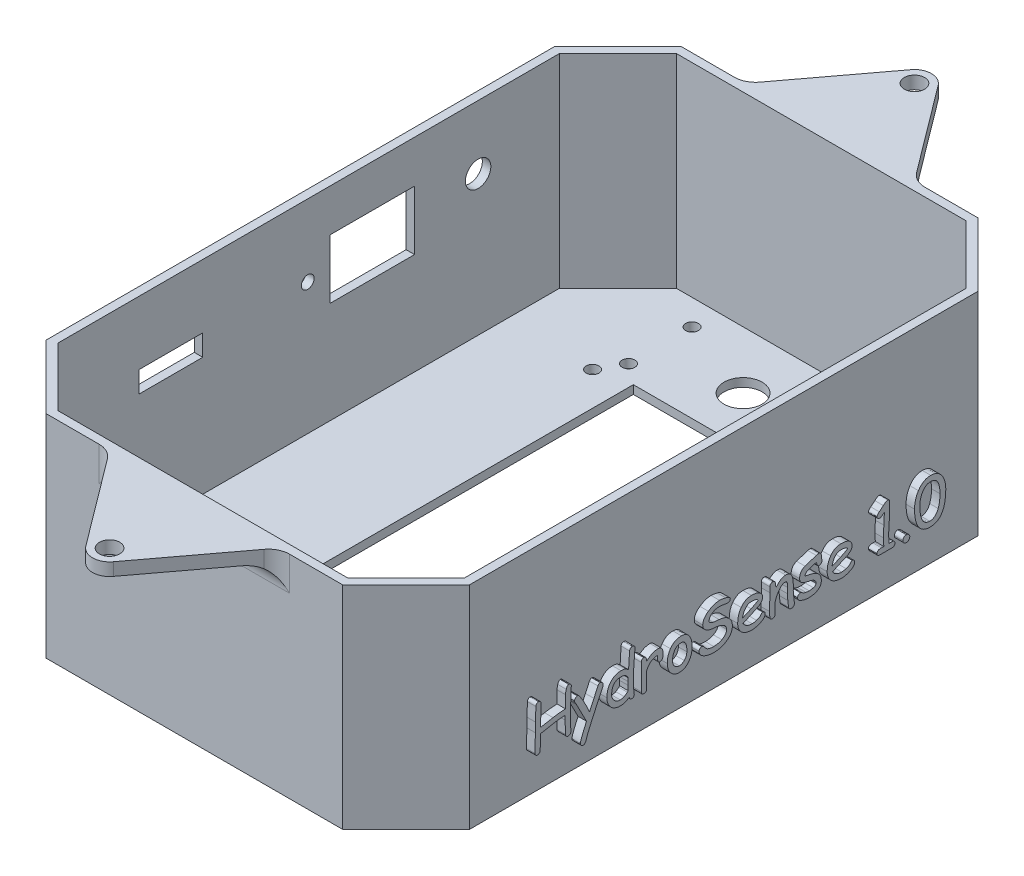
from build123d import *

# Parameters (mm, degrees)
SKETCH1_W           = 96
SKETCH1_H           = 146
BOSS_EXTRUDE1_DEPTH = 2
SKETCH1_3_W         = 100
SKETCH1_3_H         = 150
BOSS_EXTRUDE2_DEPTH = 50
SKETCH5_R           = 3
CUT_EXTRUDE1_DEPTH  = 70
SKETCH6_W           = 39.16
SKETCH6_H           = 96.45
SKETCH6_R           = 1.5
CUT_EXTRUDE2_DEPTH  = 70
SKETCH7_R           = 6
SKETCH7_R_2         = 1.5
CUT_EXTRUDE3_DEPTH  = 70
SKETCH8_R           = 4.5
SKETCH8_R_2         = 1.5
CUT_EXTRUDE4_DEPTH  = 70
SKETCH9_R           = 1.5
SKETCH9_W           = 20
SKETCH9_H           = 14
CUT_EXTRUDE5_DEPTH  = 70
SKETCH10_R          = 2.4
BOSS_EXTRUDE4_DEPTH = 3
FILLET2_R           = 5
BOSS_EXTRUDE5_DEPTH = 2
CUT_EXTRUDE7_DEPTH  = 206.14385204
BOSS_EXTRUDE7_DEPTH = 50
SKETCH11_W          = 15
SKETCH11_H          = 5
CUT_EXTRUDE8_DEPTH  = 70


with BuildPart() as part:
    # Sketch1 → Boss-Extrude1 (new body)
    with BuildSketch(Plane(origin=(0, 0, 0), x_dir=(1, 0, 0), z_dir=(0, 1, 0))):
        with Locations((48, 73)):
            Rectangle(SKETCH1_W, SKETCH1_H)
    extrude(amount=BOSS_EXTRUDE1_DEPTH)

    # Sketch1<3> → Boss-Extrude2 (add)
    with BuildSketch(Plane(origin=(0, 0, 0), x_dir=(1, 0, 0), z_dir=(0, 1, 0))):
        with Locations((48, 73)):
            Rectangle(SKETCH1_3_W, SKETCH1_3_H)
        Polygon((0, 146), (48, 146), (96, 146), (96, 0), (48, 0), (0, 0), align=None, mode=Mode.SUBTRACT)
    extrude(amount=BOSS_EXTRUDE2_DEPTH)

    # Sketch5 → Cut-Extrude1 (cut)
    with BuildSketch(Plane.ZY.offset(2)):
        with Locations((-113, 35)):
            Circle(SKETCH5_R)
    extrude(amount=-CUT_EXTRUDE1_DEPTH, mode=Mode.SUBTRACT)

    # Sketch6 → Cut-Extrude2 (cut)
    with BuildSketch(Plane.XZ):
        with Locations((48, -73)):
            Rectangle(SKETCH6_W, SKETCH6_H)
        with Locations((75.495, -26.49)):
            Circle(SKETCH6_R)
        with Locations((20.505, -26.49)):
            Circle(SKETCH6_R)
        with Locations((20.505, -119.51)):
            Circle(SKETCH6_R)
        with Locations((75.495, -119.51)):
            Circle(SKETCH6_R)
    extrude(amount=-CUT_EXTRUDE2_DEPTH, mode=Mode.SUBTRACT)

    # Sketch7 → Cut-Extrude3 (cut)
    with BuildSketch(Plane.XZ):
        with Locations((55, -12.87299943)):
            Circle(SKETCH7_R)
        with Locations((45.05, -12.87299943)):
            Circle(SKETCH7_R_2)
    extrude(amount=-CUT_EXTRUDE3_DEPTH, mode=Mode.SUBTRACT)

    # Sketch8 → Cut-Extrude4 (cut)
    with BuildSketch(Plane.XZ):
        with Locations((66.5, -132.442400563)):
            Circle(SKETCH8_R)
        with Locations((54.8, -132.442400563)):
            Circle(SKETCH8_R)
        with Locations((43.1, -132.442400563)):
            Circle(SKETCH8_R)
        with Locations((23.56, -124.942400563)):
            Circle(SKETCH8_R_2)
        with Locations((23.56, -139.942400563)):
            Circle(SKETCH8_R_2)
    extrude(amount=-CUT_EXTRUDE4_DEPTH, mode=Mode.SUBTRACT)

    # Sketch9 → Cut-Extrude5 (cut)
    with BuildSketch(Plane.ZY.offset(2)):
        with Locations((-72.78, 33)):
            Circle(SKETCH9_R)
        with Locations((-88, 33)):
            Rectangle(SKETCH9_W, SKETCH9_H)
    extrude(amount=-CUT_EXTRUDE5_DEPTH, mode=Mode.SUBTRACT)

    # Sketch10 → Boss-Extrude4 (add)
    # profile 1 of 2: a face of its own
    with BuildSketch(Plane(origin=(0, 50, 0), x_dir=(1, 0, 0), z_dir=(0, 1, 0))):
        with BuildLine():
            Line((28, 148), (68, 148))
            Line((68, 148), (51.241188031, 170.344077675))
            ThreePointArc((51.241188031, 170.344077675), (48, 172), (44.758811969, 170.344077675))
            Line((44.758811969, 170.344077675), (28, 148))
        make_face()
        with Locations((48, 168)):
            Circle(SKETCH10_R, mode=Mode.SUBTRACT)
    # profile 2 of 2: a face of its own
    with BuildSketch(Plane(origin=(0, 50, 0), x_dir=(1, 0, 0), z_dir=(0, 1, 0))):
        with BuildLine():
            Line((51.241188031, -24.344077675), (68, -2))
            Line((68, -2), (28, -2))
            Line((28, -2), (44.758811969, -24.344077675))
            ThreePointArc((44.758811969, -24.344077675), (48, -26), (51.241188031, -24.344077675))
        make_face()
        with Locations((48, -22)):
            Circle(SKETCH10_R, mode=Mode.SUBTRACT)
    extrude(amount=-BOSS_EXTRUDE4_DEPTH)

    # Fillet2
    fillet2_edges = [part.edges().sort_by_distance(p)[0] for p in [
        (68, 48.5, 2),
        (48, 47, 2),
        (28, 48.5, 2),
        (28, 48.5, -148),
        (48, 47, -148),
        (68, 48.5, -148),
    ]]
    fillet(fillet2_edges, radius=FILLET2_R)

    # Sketch12 → Boss-Extrude5 (add)
    # profile 1 of 13: a face of its own
    with BuildSketch(Plane(origin=(98, 0, 0), x_dir=(0, 0, -1), z_dir=(1, 0, 0))):
        with BuildLine():
            add(Edge.make_bspline(
                [(34.974850068, 19.027326528), (34.963003923, 18.976044021), (34.936956167, 18.863282088), (34.912879582, 18.67575953), (34.900637153, 18.455881817), (34.898088318, 18.298827401), (34.896725068, 18.214826528)],
                knots=[0, 0, 0, 0, 0.771554813, 1.696524142, 2.767981263, 4, 4, 4, 4], degree=3))
            add(Edge.make_bspline(
                [(34.896725068, 18.214826528), (34.896725068, 18.177717153), (34.896725068, 18.095685903), (34.896725068, 17.960269237), (34.896725068, 17.800764028), (34.896725068, 17.62563382), (34.896725068, 17.451154653), (34.896725068, 17.292951528), (34.896725068, 17.158185903), (34.896725068, 17.076154653), (34.896725068, 17.039045278)],
                knots=[0, 0, 0, 0, 0.757475083, 1.674418605, 2.764119601, 4.013289037, 5.249169435, 6.325581395, 7.242524917, 8, 8, 8, 8], degree=3))
            add(Edge.make_bspline(
                [(34.896725068, 17.039045278), (34.897045936, 16.98044799), (34.897723393, 16.856729582), (34.891998636, 16.660804426), (34.889963937, 16.444585081), (34.880128675, 16.208345458), (34.87420291, 15.951725866), (34.860493856, 15.675155889), (34.85078704, 15.378139531), (34.83320312, 15.068418005), (34.821631433, 14.758399699), (34.806023176, 14.462309515), (34.798131169, 14.186144605), (34.786357391, 13.930392755), (34.782376941, 13.693971239), (34.774651369, 13.477890446), (34.774020227, 13.281878265), (34.772462801, 13.158184363), (34.771725068, 13.099592153)],
                knots=[0, 0, 0, 0, 0.713509843, 1.506457098, 2.386595404, 3.346393763, 4.385431011, 5.51219548, 6.718172788, 8.004055554, 9.289571682, 10.4958877, 11.614422393, 12.653731811, 13.613300948, 14.493617763, 15.286446115, 16, 16, 16, 16], degree=3))
            add(Edge.make_bspline(
                [(34.771725068, 13.099592153), (34.77246579, 13.055323386), (34.77404525, 12.960927944), (34.774607892, 12.811774082), (34.782384116, 12.647147107), (34.786425014, 12.466689372), (34.798079396, 12.270860622), (34.80607644, 12.058465884), (34.821562601, 11.831419737), (34.833299434, 11.592988768), (34.850675744, 11.355573303), (34.860550345, 11.127534097), (34.874222398, 10.915452047), (34.88011292, 10.718042919), (34.889948598, 10.536517679), (34.892014043, 10.370407172), (34.897717374, 10.220065975), (34.897043491, 10.124987337), (34.896725068, 10.080060903)],
                knots=[0, 0, 0, 0, 0.703121506, 1.499284267, 2.368305918, 3.319990682, 4.365498796, 5.483296447, 6.695111295, 7.979176565, 9.274183652, 10.475099786, 11.6037464, 12.648794332, 13.611201385, 14.490251481, 15.286615606, 16, 16, 16, 16], degree=3))
            add(Edge.make_bspline(
                [(34.896725068, 10.080060903), (34.894478842, 10.036219508), (34.890118072, 9.951106896), (34.855818032, 9.828608849), (34.798273099, 9.7178643), (34.72010113, 9.620965706), (34.626922821, 9.539724042), (34.518491442, 9.4825456), (34.399115576, 9.445447221), (34.314978362, 9.441476945), (34.271725068, 9.439435903)],
                knots=[0, 0, 0, 0, 1.053074647, 2.044413327, 3.031664506, 4.034066205, 5.022309845, 5.981866149, 6.9625169, 8, 8, 8, 8], degree=3))
            add(Edge.make_bspline(
                [(34.271725068, 9.439435903), (34.229756076, 9.441488237), (34.147512995, 9.445510021), (34.029876326, 9.483416854), (33.920468256, 9.539539352), (33.825510094, 9.620958897), (33.745028705, 9.717236326), (33.687719963, 9.828678401), (33.653491958, 9.950457648), (33.649014643, 10.034917405), (33.646725068, 10.078107778)],
                knots=[0, 0, 0, 0, 1.009602801, 1.978433119, 2.954998479, 3.95847425, 4.974045678, 5.964531323, 6.959117862, 8, 8, 8, 8], degree=3))
            add(Edge.make_bspline(
                [(33.646725068, 10.078107778), (33.647042538, 10.123034187), (33.647714406, 10.218112772), (33.642052739, 10.36780391), (33.639895005, 10.533260979), (33.630174947, 10.713487977), (33.624155422, 10.910241049), (33.610547292, 11.121674313), (33.600747822, 11.349067655), (33.583218581, 11.585822068), (33.571578058, 11.823608186), (33.556062141, 12.050652616), (33.548142316, 12.262400274), (33.536382936, 12.457572415), (33.532347003, 12.638031369), (33.524670756, 12.80266129), (33.524021724, 12.951812935), (33.522461737, 13.045557675), (33.521725068, 13.089826528)],
                knots=[0, 0, 0, 0, 0.715231305, 1.513657171, 2.384620309, 3.349518979, 4.386915009, 5.518483625, 6.722508863, 8.010524311, 9.297913953, 10.51286612, 11.633557685, 12.671419694, 13.625568315, 14.507198958, 15.295058152, 16, 16, 16, 16], degree=3))
            add(Edge.make_bspline(
                [(33.521725068, 13.089826528), (33.521725068, 13.251284862), (33.521725068, 13.576154653), (33.521725068, 13.901024445), (33.521725068, 14.064435903)],
                knots=[0, 0, 0, 0, 0.993987976, 2, 2, 2, 2], degree=3))
            add(Edge.make_bspline(
                [(33.521725068, 14.064435903), (33.421451278, 14.06159316), (33.21558765, 14.055756964), (32.897625456, 14.038673339), (32.563127563, 14.00788615), (32.210691545, 13.971609439), (31.84174161, 13.923414376), (31.455194107, 13.870293215), (31.051976474, 13.802091087), (30.777548504, 13.753428287), (30.636959443, 13.728498403)],
                knots=[0, 0, 0, 0, 0.828072947, 1.70004644, 2.627928539, 3.600670539, 4.624563267, 5.699255065, 6.821331625, 8, 8, 8, 8], degree=3))
            Line((30.636959443, 13.728498403), (27.771725068, 13.187482778))
            add(Edge.make_bspline(
                [(27.771725068, 13.187482778), (27.772044178, 13.136046468), (27.772718842, 13.027299218), (27.767063725, 12.856769024), (27.764972173, 12.670485871), (27.755093203, 12.468768764), (27.749322412, 12.251185178), (27.735502788, 12.018262644), (27.72580622, 11.770046111), (27.708204681, 11.511792384), (27.696614187, 11.253183152), (27.680958149, 11.005298113), (27.67311925, 10.772727029), (27.661295123, 10.555407554), (27.657364243, 10.352822093), (27.649611287, 10.16539792), (27.649019149, 9.99346588), (27.647465098, 9.884095521), (27.646725068, 9.832014028)],
                knots=[0, 0, 0, 0, 0.735133238, 1.554227294, 2.43844416, 3.397631498, 4.440510175, 5.549269433, 6.732384057, 7.990828212, 9.248756196, 10.432346458, 11.540676094, 12.574632205, 13.542805101, 14.436567656, 15.255503121, 16, 16, 16, 16], degree=3))
            add(Edge.make_bspline(
                [(27.646725068, 9.832014028), (27.64442119, 9.788833929), (27.639915903, 9.704394264), (27.605890268, 9.582469659), (27.547769589, 9.471487396), (27.470162471, 9.373108155), (27.377541877, 9.289619463), (27.268427102, 9.232627244), (27.149132907, 9.195425228), (27.064984247, 9.191469477), (27.021725068, 9.189435903)],
                knots=[0, 0, 0, 0, 1.036586637, 2.027068727, 3.013466847, 4.027263332, 5.024882792, 5.983609968, 6.963413363, 8, 8, 8, 8], degree=3))
            add(Edge.make_bspline(
                [(27.021725068, 9.189435903), (26.978499308, 9.191526767), (26.894415653, 9.195593958), (26.774355809, 9.232092622), (26.666304457, 9.292535393), (26.571422223, 9.374253536), (26.493408316, 9.473030162), (26.438002451, 9.584955546), (26.403395796, 9.706282305), (26.398982106, 9.790765033), (26.396725068, 9.833967153)],
                knots=[0, 0, 0, 0, 1.035004602, 2.013312624, 2.978063759, 3.985966481, 4.998215713, 5.976024979, 6.964995398, 8, 8, 8, 8], degree=3))
            add(Edge.make_bspline(
                [(26.396725068, 9.833967153), (26.397465593, 9.895163568), (26.399041169, 10.025367871), (26.399610556, 10.231144369), (26.407427494, 10.458945085), (26.411326968, 10.70773363), (26.42315148, 10.977812536), (26.431039572, 11.269595723), (26.446591803, 11.582622677), (26.458269776, 11.910858843), (26.475703495, 12.238174438), (26.485534081, 12.552105182), (26.499177969, 12.843658005), (26.505153107, 13.114593161), (26.514951219, 13.363859415), (26.516992549, 13.591793359), (26.522729178, 13.798136931), (26.522048405, 13.928364804), (26.521725068, 13.990217153)],
                knots=[0, 0, 0, 0, 0.706432232, 1.503037674, 2.375047256, 3.337207256, 4.374931679, 5.49526882, 6.706296454, 7.992405416, 9.286350305, 10.489565229, 11.617688338, 12.655167844, 13.617533249, 14.496894618, 15.286092928, 16, 16, 16, 16], degree=3))
            add(Edge.make_bspline(
                [(26.521725068, 13.990217153), (26.521725068, 14.057925487), (26.521725068, 14.208967153), (26.521725068, 14.458316112), (26.521725068, 14.753889028), (26.521725068, 15.080060903), (26.521725068, 15.40688382), (26.521725068, 15.703107778), (26.521725068, 15.954409862), (26.521725068, 16.106753612), (26.521725068, 16.175764028)],
                knots=[0, 0, 0, 0, 0.743521001, 1.658623771, 2.738159071, 3.989276139, 5.240393208, 6.327077748, 7.242180518, 8, 8, 8, 8], degree=3))
            add(Edge.make_bspline(
                [(26.521725068, 16.175764028), (26.522464142, 16.221985997), (26.52402555, 16.319637064), (26.524630272, 16.473996457), (26.53242213, 16.644484807), (26.536352386, 16.831453127), (26.548134331, 17.034442451), (26.556038823, 17.253997795), (26.571632726, 17.489507467), (26.583201567, 17.736406245), (26.600795039, 17.982931611), (26.610423757, 18.218790452), (26.624244947, 18.438030928), (26.630121868, 18.64129622), (26.63991862, 18.828034357), (26.642023319, 18.998698257), (26.647703485, 19.152296422), (26.647037768, 19.249327382), (26.646725068, 19.294904653)],
                knots=[0, 0, 0, 0, 0.71073616, 1.501540189, 2.372873447, 3.33424259, 4.376420019, 5.498586659, 6.711746118, 8.004855192, 9.298545221, 10.511167765, 11.633825341, 12.675570082, 13.637303902, 14.508349659, 15.299343701, 16, 16, 16, 16], degree=3))
            add(Edge.make_bspline(
                [(26.646725068, 19.294904653), (26.648947531, 19.339406021), (26.653263017, 19.42581695), (26.687658771, 19.549203883), (26.742953942, 19.661389893), (26.821475978, 19.758760959), (26.9169681, 19.838003924), (27.023942758, 19.899370226), (27.144803737, 19.932623234), (27.228569169, 19.937119454), (27.271725068, 19.939435903)],
                knots=[0, 0, 0, 0, 1.063528662, 2.065116271, 3.04055338, 4.038134379, 5.033523158, 5.995933815, 6.96750631, 8, 8, 8, 8], degree=3))
            add(Edge.make_bspline(
                [(27.271725068, 19.939435903), (27.31498628, 19.937403933), (27.399138896, 19.933451302), (27.518404871, 19.89622703), (27.627624786, 19.83931773), (27.71945576, 19.755852487), (27.798372793, 19.659168663), (27.855790154, 19.548279758), (27.890307581, 19.425188893), (27.894533034, 19.339406116), (27.896725068, 19.294904653)],
                knots=[0, 0, 0, 0, 1.034143852, 2.011638275, 2.968106146, 3.963374651, 4.962550014, 5.946623622, 6.934771574, 8, 8, 8, 8], degree=3))
            add(Edge.make_bspline(
                [(27.896725068, 19.294904653), (27.897045118, 19.248025251), (27.897720889, 19.149041349), (27.892028879, 18.992838575), (27.889918559, 18.820222658), (27.880134753, 18.631529619), (27.874190572, 18.425665062), (27.860497445, 18.203812111), (27.85078564, 17.965354959), (27.833205478, 17.716874045), (27.821627775, 17.468023838), (27.806035384, 17.230559547), (27.798130681, 17.009052406), (27.786349641, 16.804108607), (27.782418603, 16.615188349), (27.774627918, 16.442745876), (27.774024759, 16.286434025), (27.77246426, 16.187480807), (27.771725068, 16.140607778)],
                knots=[0, 0, 0, 0, 0.712656651, 1.504744786, 2.375994508, 3.336917369, 4.376962179, 5.506896972, 6.715913556, 8.005088862, 9.293694081, 10.503237266, 11.622806665, 12.663275282, 13.623841235, 14.495372032, 15.287274616, 16, 16, 16, 16], degree=3))
            Line((27.771725068, 16.140607778), (27.771725068, 14.474592153))
            Line((27.771725068, 14.474592153), (30.687740693, 14.994123403))
            add(Edge.make_bspline(
                [(30.687740693, 14.994123403), (30.830232585, 15.018742691), (31.109006442, 15.066908335), (31.520068605, 15.128724327), (31.913806261, 15.184149254), (32.290841584, 15.22902691), (32.650265594, 15.264706496), (32.99222951, 15.289382103), (33.317098672, 15.308531688), (33.528210825, 15.312501262), (33.631100068, 15.314435903)],
                knots=[0, 0, 0, 0, 1.170907733, 2.290786245, 3.365891869, 4.390567948, 5.365227954, 6.290352425, 7.166773002, 8, 8, 8, 8], degree=3))
            add(Edge.make_bspline(
                [(33.631100068, 15.314435903), (33.63239788, 15.399071199), (33.635153199, 15.578756112), (33.639607096, 15.863250797), (33.640761303, 16.177718477), (33.642989859, 16.522117109), (33.644707217, 16.897118259), (33.647324714, 17.302714135), (33.646557894, 17.738915475), (33.646668072, 18.039696458), (33.646725068, 18.195295278)],
                knots=[0, 0, 0, 0, 0.705149043, 1.497066249, 2.37027973, 3.324845499, 4.36618729, 5.494305301, 6.703763997, 8, 8, 8, 8], degree=3))
            add(Edge.make_bspline(
                [(33.646725068, 18.195295278), (33.648695746, 18.280004301), (33.652678811, 18.45121517), (33.682496708, 18.708662545), (33.733836213, 18.967512552), (33.781057765, 19.138272992), (33.804928193, 19.224592153)],
                knots=[0, 0, 0, 0, 0.972662938, 1.965911812, 2.9717713, 4, 4, 4, 4], degree=3))
            add(Edge.make_bspline(
                [(33.804928193, 19.224592153), (33.821896335, 19.281052474), (33.853990135, 19.387842383), (33.918587091, 19.531877032), (33.981084667, 19.657881154), (34.053548057, 19.759187535), (34.129873499, 19.841389288), (34.215201446, 19.895702065), (34.304621075, 19.932845066), (34.367063607, 19.937220584), (34.398678193, 19.939435903)],
                knots=[0, 0, 0, 0, 1.422267291, 2.690097947, 3.808489769, 4.812092364, 5.690611963, 6.497531071, 7.239301606, 8, 8, 8, 8], degree=3))
            add(Edge.make_bspline(
                [(34.398678193, 19.939435903), (34.437954468, 19.937040833), (34.515974102, 19.932283188), (34.629538543, 19.898214051), (34.735312175, 19.838825898), (34.833290746, 19.760424892), (34.916475752, 19.663973549), (34.97988715, 19.553932617), (35.015366032, 19.429859963), (35.019566344, 19.343298585), (35.021725068, 19.298810903)],
                knots=[0, 0, 0, 0, 0.950457943, 1.888019694, 2.840305694, 3.871746475, 4.911225358, 5.906377803, 6.923995902, 8, 8, 8, 8], degree=3))
            add(Edge.make_bspline(
                [(35.021725068, 19.298810903), (35.018846024, 19.259580687), (35.012098379, 19.167636452), (34.988423495, 19.078455999), (34.974850068, 19.027326528)],
                knots=[0, 0, 0, 0, 0.853348034, 2, 2, 2, 2], degree=3))
        make_face()
    # profile 2 of 13: a face of its own
    with BuildSketch(Plane(origin=(98, 0, 0), x_dir=(0, 0, -1), z_dir=(1, 0, 0))):
        with BuildLine():
            Line((42.500240693, 15.540998403), (40.181881318, 10.624982778))
            add(Edge.make_bspline(
                [(40.181881318, 10.624982778), (40.112721311, 10.478568448), (39.977627021, 10.192568764), (39.782079945, 9.77209818), (39.597881321, 9.370299298), (39.428426039, 8.985013233), (39.269942607, 8.618852617), (39.125338833, 8.270272829), (38.992496216, 7.940832164), (38.909517537, 7.726635239), (38.869381318, 7.623029653)],
                knots=[0, 0, 0, 0, 1.185835995, 2.316362875, 3.395946504, 4.422714135, 5.398712484, 6.317793961, 7.186328456, 8, 8, 8, 8], degree=3))
            Line((38.869381318, 7.623029653), (38.427975068, 6.347639028))
            add(Edge.make_bspline(
                [(38.427975068, 6.347639028), (38.413336742, 6.305572578), (38.385481031, 6.225523069), (38.330043956, 6.116721629), (38.267430753, 6.02388097), (38.197113352, 5.945611616), (38.116161122, 5.886728025), (38.027473816, 5.844510543), (37.931425665, 5.818298515), (37.864338213, 5.815735555), (37.830318818, 5.814435903)],
                knots=[0, 0, 0, 0, 1.235991964, 2.352006154, 3.380181255, 4.339930222, 5.258597469, 6.140212165, 7.05691968, 8, 8, 8, 8], degree=3))
            add(Edge.make_bspline(
                [(37.830318818, 5.814435903), (37.785160872, 5.816582598), (37.696655785, 5.820789907), (37.568191438, 5.857454864), (37.450679249, 5.91879894), (37.345520367, 6.00081528), (37.256274465, 6.099530623), (37.194285664, 6.215170611), (37.151763764, 6.340809041), (37.148430588, 6.429308669), (37.146725068, 6.474592153)],
                knots=[0, 0, 0, 0, 1.023606654, 2.006167323, 3.004277025, 4.015323613, 5.020520316, 5.999517743, 6.976393346, 8, 8, 8, 8], degree=3))
            add(Edge.make_bspline(
                [(37.146725068, 6.474592153), (37.147941169, 6.506571731), (37.15063966, 6.57753351), (37.172909526, 6.691955414), (37.202481301, 6.825991147), (37.241018961, 6.97943215), (37.292689562, 7.151801142), (37.355437551, 7.343184213), (37.429351823, 7.553642932), (37.516723023, 7.782707087), (37.611611456, 8.031716862), (37.716892889, 8.300576096), (37.83667756, 8.586260787), (37.96599252, 8.892353224), (38.105747998, 9.217618546), (38.259195269, 9.561252296), (38.420657061, 9.925118236), (38.533867492, 10.173262105), (38.592037568, 10.300764028)],
                knots=[0, 0, 0, 0, 0.373930967, 0.82974225, 1.360148952, 1.980874544, 2.679813033, 3.465064369, 4.337133929, 5.289256639, 6.333227822, 7.454891416, 8.667164621, 9.957383291, 11.342606331, 12.808949494, 14.360366181, 16, 16, 16, 16], degree=3))
            Line((38.592037568, 10.300764028), (36.244381318, 14.861310903))
            Line((36.244381318, 14.861310903), (35.949459443, 15.343732778))
            add(Edge.make_bspline(
                [(35.949459443, 15.343732778), (35.922326295, 15.392032141), (35.87171847, 15.482118468), (35.816599427, 15.616491456), (35.780132133, 15.738318295), (35.774401221, 15.816834054), (35.771725068, 15.853498403)],
                knots=[0, 0, 0, 0, 1.217991762, 2.271756755, 3.19296566, 4, 4, 4, 4], degree=3))
            add(Edge.make_bspline(
                [(35.771725068, 15.853498403), (35.774635968, 15.899290195), (35.78038872, 15.989787577), (35.817925182, 16.121585225), (35.885057882, 16.242628975), (35.973621988, 16.352499589), (36.079067997, 16.44349273), (36.191464129, 16.515835783), (36.314037838, 16.555980568), (36.397767974, 16.561614732), (36.439693818, 16.564435903)],
                knots=[0, 0, 0, 0, 1.023084226, 2.021900477, 3.03051496, 4.095730577, 5.157366296, 6.13011498, 7.063700203, 8, 8, 8, 8], degree=3))
            add(Edge.make_bspline(
                [(36.439693818, 16.564435903), (36.487658094, 16.56171836), (36.580265445, 16.556471445), (36.710405853, 16.507353201), (36.822064394, 16.424542969), (36.87645272, 16.349354965), (36.904537568, 16.310529653)],
                knots=[0, 0, 0, 0, 1.03565372, 1.999595438, 2.967038292, 4, 4, 4, 4], degree=3))
            add(Edge.make_bspline(
                [(36.904537568, 16.310529653), (36.999288768, 16.17382642), (37.195911268, 15.890147354), (37.481517416, 15.435682681), (37.774724955, 14.941822144), (38.071350608, 14.405247961), (38.373289571, 13.827195247), (38.681937168, 13.208251246), (38.994209937, 12.547527709), (39.199545545, 12.091465554), (39.304928193, 11.857404653)],
                knots=[0, 0, 0, 0, 0.787796816, 1.634792816, 2.541842998, 3.508143451, 4.538559296, 5.630857437, 6.784105113, 8, 8, 8, 8], degree=3))
            Line((39.304928193, 11.857404653), (40.340084443, 14.113264028))
            add(Edge.make_bspline(
                [(40.340084443, 14.113264028), (40.426583809, 14.303408895), (40.594027408, 14.671487213), (40.838560738, 15.205162592), (41.066941181, 15.702321883), (41.213173527, 16.022098845), (41.283443818, 16.175764028)],
                knots=[0, 0, 0, 0, 1.105263586, 2.13954533, 3.105979663, 4, 4, 4, 4], degree=3))
            add(Edge.make_bspline(
                [(41.283443818, 16.175764028), (41.318440687, 16.234567739), (41.383991002, 16.344709071), (41.519254516, 16.469594926), (41.670957655, 16.55234581), (41.781151565, 16.560409303), (41.836178193, 16.564435903)],
                knots=[0, 0, 0, 0, 1.149695914, 2.153419211, 3.077888109, 4, 4, 4, 4], degree=3))
            add(Edge.make_bspline(
                [(41.836178193, 16.564435903), (41.880115668, 16.562532377), (41.967849596, 16.558731433), (42.093724997, 16.517105053), (42.211893679, 16.453476834), (42.316837765, 16.366223381), (42.407111195, 16.263404326), (42.475223846, 16.148083462), (42.513450097, 16.019883037), (42.518918845, 15.931866284), (42.521725068, 15.886701528)],
                knots=[0, 0, 0, 0, 0.985733086, 1.968302392, 2.951854649, 3.993202275, 5.021581179, 6.019438827, 6.983698468, 8, 8, 8, 8], degree=3))
            add(Edge.make_bspline(
                [(42.521725068, 15.886701528), (42.520388117, 15.832627737), (42.517532547, 15.717132471), (42.506244032, 15.602148151), (42.500240693, 15.540998403)],
                knots=[0, 0, 0, 0, 0.936381098, 2, 2, 2, 2], degree=3))
        make_face()
    # profile 3 of 13: a face of its own
    with BuildSketch(Plane(origin=(98, 0, 0), x_dir=(0, 0, -1), z_dir=(1, 0, 0))):
        with BuildLine():
            add(Edge.make_bspline(
                [(49.732662568, 15.535139028), (49.707597471, 15.214335196), (49.657517018, 14.573364152), (49.650320002, 13.930480396), (49.646725068, 13.609357778)],
                knots=[0, 0, 0, 0, 1.000993213, 2, 2, 2, 2], degree=3))
            add(Edge.make_bspline(
                [(49.646725068, 13.609357778), (49.647580764, 13.433572085), (49.64924158, 13.092390129), (49.658968607, 12.59754726), (49.674507745, 12.135909852), (49.695102899, 11.707361798), (49.724362046, 11.312098196), (49.759575916, 10.950050149), (49.798605738, 10.621352217), (49.834676882, 10.414568436), (49.851803193, 10.316389028)],
                knots=[0, 0, 0, 0, 1.277190667, 2.478895762, 3.595865585, 4.63308663, 5.595936305, 6.475156791, 7.276015736, 8, 8, 8, 8], degree=3))
            add(Edge.make_bspline(
                [(49.851803193, 10.316389028), (49.855733729, 10.289095023), (49.862918071, 10.239206277), (49.863333703, 10.188818952), (49.863521943, 10.165998403)],
                knots=[0, 0, 0, 0, 1.094194912, 2, 2, 2, 2], degree=3))
            add(Edge.make_bspline(
                [(49.863521943, 10.165998403), (49.861523997, 10.124011682), (49.857638497, 10.04235815), (49.819759356, 9.926629074), (49.763919302, 9.819878454), (49.679848414, 9.732454485), (49.585928011, 9.657462805), (49.480482627, 9.605094663), (49.368542106, 9.568432772), (49.290258831, 9.565787935), (49.250240693, 9.564435903)],
                knots=[0, 0, 0, 0, 1.05177295, 2.045431781, 3.033958183, 4.053154166, 5.067742846, 6.04098465, 6.998558172, 8, 8, 8, 8], degree=3))
            add(Edge.make_bspline(
                [(49.250240693, 9.564435903), (49.216850261, 9.566369991), (49.151505315, 9.570154992), (49.056730361, 9.598596714), (48.969994848, 9.647031281), (48.888438823, 9.712205836), (48.816439559, 9.797870983), (48.751821777, 9.901465656), (48.693175045, 10.022518563), (48.662682123, 10.111579828), (48.646725068, 10.158185903)],
                knots=[0, 0, 0, 0, 0.880039557, 1.722234004, 2.582959466, 3.486806042, 4.461005431, 5.518665856, 6.701509044, 8, 8, 8, 8], degree=3))
            add(Edge.make_bspline(
                [(48.646725068, 10.158185903), (48.567342047, 10.102455098), (48.410539692, 9.992372094), (48.165621102, 9.847042459), (47.914894734, 9.724511834), (47.661184473, 9.61972218), (47.401173368, 9.538541498), (47.135497232, 9.483269479), (46.864575741, 9.445873762), (46.682006791, 9.44159183), (46.590084443, 9.439435903)],
                knots=[0, 0, 0, 0, 1.049993693, 2.074013819, 3.079720164, 4.069387572, 5.043772359, 6.024055475, 7.005124043, 8, 8, 8, 8], degree=3))
            add(Edge.make_bspline(
                [(46.590084443, 9.439435903), (46.478598579, 9.441762279), (46.259323119, 9.446337901), (45.937827356, 9.491382959), (45.629765842, 9.559990545), (45.338142206, 9.66132815), (45.05913857, 9.785805581), (44.797762596, 9.943693656), (44.54911769, 10.127563838), (44.398596011, 10.269852038), (44.322506318, 10.341779653)],
                knots=[0, 0, 0, 0, 1.066325706, 2.097297811, 3.10088944, 4.082125601, 5.046904096, 6.019277733, 6.998731951, 8, 8, 8, 8], degree=3))
            add(Edge.make_bspline(
                [(44.322506318, 10.341779653), (44.248342738, 10.41960052), (44.101152905, 10.574048842), (43.91488225, 10.832978288), (43.75188727, 11.104682987), (43.624217095, 11.396263671), (43.521255054, 11.701902698), (43.450526341, 12.024148452), (43.402971884, 12.361845936), (43.398836893, 12.592910759), (43.396725068, 12.710920278)],
                knots=[0, 0, 0, 0, 0.986177228, 1.957231056, 2.922154339, 3.89105213, 4.874234197, 5.879440261, 6.916986874, 8, 8, 8, 8], degree=3))
            add(Edge.make_bspline(
                [(43.396725068, 12.710920278), (43.3988356, 12.852987943), (43.402961463, 13.130714959), (43.450191484, 13.535995861), (43.520513118, 13.919890585), (43.62285374, 14.282031154), (43.753402438, 14.622113586), (43.912445172, 14.94207345), (44.102132435, 15.238981882), (44.319589304, 15.512351095), (44.557463938, 15.760218633), (44.817948761, 15.974349493), (45.094186044, 16.157721578), (45.388772523, 16.306322231), (45.700332612, 16.423306656), (46.029622802, 16.503350632), (46.375432865, 16.557115256), (46.612008581, 16.561963362), (46.732662568, 16.564435903)],
                knots=[0, 0, 0, 0, 1.189608909, 2.325557561, 3.413444142, 4.456306596, 5.473245952, 6.461102674, 7.444553072, 8.419008956, 9.383292003, 10.316965006, 11.238209328, 12.155343605, 13.075214562, 14.01970527, 14.990046571, 16, 16, 16, 16], degree=3))
            add(Edge.make_bspline(
                [(46.732662568, 16.564435903), (46.851962295, 16.561437713), (47.077739315, 16.555763579), (47.394947365, 16.514111611), (47.671826535, 16.443865707), (47.831323359, 16.365187216), (47.906490693, 16.328107778)],
                knots=[0, 0, 0, 0, 1.183286269, 2.239391947, 3.170264262, 4, 4, 4, 4], degree=3))
            Line((47.906490693, 16.328107778), (48.521725068, 15.873029653))
            add(Edge.make_bspline(
                [(48.521725068, 15.873029653), (48.530066617, 16.09438842), (48.546039315, 16.518254196), (48.570857493, 17.12573691), (48.5979684, 17.677204267), (48.627378268, 18.171968144), (48.656489976, 18.610151217), (48.685317039, 18.991767371), (48.714952336, 19.316910805), (48.740611017, 19.514364273), (48.752193818, 19.603498403)],
                knots=[0, 0, 0, 0, 1.421995194, 2.722887861, 3.902897711, 4.96628555, 5.904542012, 6.721910156, 7.423046717, 8, 8, 8, 8], degree=3))
            add(Edge.make_bspline(
                [(48.752193818, 19.603498403), (48.760435393, 19.649485009), (48.776182089, 19.737348934), (48.822739516, 19.856956728), (48.877964782, 19.96152184), (48.952641011, 20.045774861), (49.041331121, 20.110865922), (49.144576395, 20.156698571), (49.261206801, 20.184020521), (49.343836413, 20.187578863), (49.386959443, 20.189435903)],
                knots=[0, 0, 0, 0, 1.166727176, 2.229197586, 3.199552252, 4.111778525, 5.021234505, 5.933023923, 6.921279318, 8, 8, 8, 8], degree=3))
            add(Edge.make_bspline(
                [(49.386959443, 20.189435903), (49.436566024, 20.187740041), (49.530255286, 20.184537158), (49.662208685, 20.156110984), (49.773283083, 20.104219963), (49.867692713, 20.035403548), (49.936509128, 19.940993918), (49.988400148, 19.82991952), (50.016826323, 19.697966121), (50.020029206, 19.604276859), (50.021725068, 19.554670278)],
                knots=[0, 0, 0, 0, 1.156676403, 2.184552079, 3.122193726, 4, 4.877806274, 5.815447921, 6.843323597, 8, 8, 8, 8], degree=3))
            add(Edge.make_bspline(
                [(50.021725068, 19.554670278), (50.020999241, 19.513656306), (50.01945544, 19.426421476), (50.01861071, 19.287039541), (50.011708293, 19.130819947), (50.003966489, 18.956995317), (49.994872756, 18.765501187), (49.979690708, 18.557338685), (49.9675655, 18.331892811), (49.948778784, 18.089175528), (49.929852794, 17.829366821), (49.907956546, 17.552052544), (49.884587998, 17.258428603), (49.859776035, 16.946472113), (49.829133257, 16.617924255), (49.801429281, 16.271967567), (49.767015511, 15.909501003), (49.744312839, 15.662098119), (49.732662568, 15.535139028)],
                knots=[0, 0, 0, 0, 0.488487756, 1.038990958, 1.659650684, 2.350346172, 3.111108541, 3.94243113, 4.835652975, 5.799528677, 6.841292333, 7.93775826, 9.112121531, 10.348929636, 11.66430314, 13.041467071, 14.481777404, 16, 16, 16, 16], degree=3))
        make_face()
        with BuildLine():
            add(Edge.make_bspline(
                [(46.748287568, 15.314435903), (46.658329978, 15.312927267), (46.483692814, 15.30999851), (46.231080148, 15.276954195), (45.994544077, 15.229553381), (45.775143483, 15.160013708), (45.574091309, 15.06653128), (45.389372727, 14.956131164), (45.223855244, 14.822838068), (45.073661329, 14.671924611), (44.942852147, 14.498534501), (44.829146448, 14.30579849), (44.733046411, 14.092949647), (44.655318298, 13.859208294), (44.595473068, 13.605476584), (44.553525923, 13.331804852), (44.52469112, 13.038357831), (44.522735498, 12.835344342), (44.521725068, 12.730451528)],
                knots=[0, 0, 0, 0, 1.104243253, 2.143698025, 3.123882987, 4.064621318, 4.962690913, 5.841762256, 6.700969171, 7.566109394, 8.450547168, 9.361167402, 10.309521801, 11.313426945, 12.382121706, 13.507473269, 14.712163689, 16, 16, 16, 16], degree=3))
            add(Edge.make_bspline(
                [(44.521725068, 12.730451528), (44.523814594, 12.662024725), (44.527950655, 12.526578904), (44.554376002, 12.327102039), (44.604866277, 12.135934382), (44.671537403, 11.951618968), (44.754649908, 11.773245767), (44.860278622, 11.603980617), (44.983322981, 11.441349801), (45.124929451, 11.28932377), (45.278135261, 11.149093862), (45.440096877, 11.025938801), (45.609026731, 10.92083825), (45.785359325, 10.837907447), (45.966430311, 10.769598104), (46.154582277, 10.723263574), (46.349658215, 10.695295633), (46.48191785, 10.691409151), (46.549068818, 10.689435903)],
                knots=[0, 0, 0, 0, 1.029546857, 2.0379122, 3.018986788, 3.998005947, 4.983762564, 5.9731616, 6.993724782, 8.047217791, 9.094088582, 10.114651764, 11.1040508, 12.080961111, 13.04158308, 14.010754683, 14.990018762, 16, 16, 16, 16], degree=3))
            add(Edge.make_bspline(
                [(46.549068818, 10.689435903), (46.638452771, 10.691097293), (46.810993323, 10.694304323), (47.057618386, 10.735264938), (47.284669634, 10.795246585), (47.421573166, 10.859289441), (47.488521943, 10.890607778)],
                knots=[0, 0, 0, 0, 1.104933255, 2.132886155, 3.08694109, 4, 4, 4, 4], degree=3))
            add(Edge.make_bspline(
                [(47.488521943, 10.890607778), (47.532531372, 10.916038879), (47.634896913, 10.975191396), (47.799727711, 11.093719524), (48.003179531, 11.244710681), (48.146656528, 11.363162232), (48.224850068, 11.427717153)],
                knots=[0, 0, 0, 0, 0.668068408, 1.553921218, 2.666911315, 4, 4, 4, 4], degree=3))
            add(Edge.make_bspline(
                [(48.224850068, 11.427717153), (48.258153656, 11.457590932), (48.327570275, 11.519858599), (48.387192046, 11.591578005), (48.418209443, 11.628889028)],
                knots=[0, 0, 0, 0, 0.959527803, 2, 2, 2, 2], degree=3))
            Line((48.418209443, 11.628889028), (48.396725068, 12.749982778))
            Line((48.396725068, 12.749982778), (48.404537568, 13.499982778))
            Line((48.404537568, 13.499982778), (48.418209443, 14.265607778))
            add(Edge.make_bspline(
                [(48.418209443, 14.265607778), (48.374910071, 14.349017656), (48.290815915, 14.511012692), (48.130229527, 14.725078265), (47.951551706, 14.908381727), (47.749447363, 15.055727442), (47.528797033, 15.17292464), (47.286658484, 15.254303788), (47.024684289, 15.307369278), (46.842311412, 15.312031999), (46.748287568, 15.314435903)],
                knots=[0, 0, 0, 0, 1.076360775, 2.090461057, 3.056777724, 4.002209313, 4.947522929, 5.911036705, 6.92301771, 8, 8, 8, 8], degree=3))
        make_face(mode=Mode.SUBTRACT)
    # profile 4 of 13: a face of its own
    with BuildSketch(Plane(origin=(98, 0, 0), x_dir=(0, 0, -1), z_dir=(1, 0, 0))):
        with BuildLine():
            add(Edge.make_bspline(
                [(56.640865693, 14.630842153), (56.635066082, 14.566857964), (56.624144222, 14.446362607), (56.588112311, 14.278252143), (56.532864048, 14.134682967), (56.4543745, 14.019006066), (56.361207556, 13.92507856), (56.246711628, 13.85942775), (56.113814676, 13.822317864), (56.020010383, 13.817142829), (55.970943818, 13.814435903)],
                knots=[0, 0, 0, 0, 1.295735659, 2.440136123, 3.460018604, 4.378359426, 5.242460733, 6.107859715, 7.010271055, 8, 8, 8, 8], degree=3))
            add(Edge.make_bspline(
                [(55.970943818, 13.814435903), (55.925868765, 13.816141381), (55.84049737, 13.819371527), (55.72076447, 13.847841549), (55.61963327, 13.899837962), (55.538059771, 13.97273341), (55.470844238, 14.062673425), (55.426495905, 14.175690692), (55.402700867, 14.30756777), (55.398788476, 14.401574971), (55.396725068, 14.451154653)],
                knots=[0, 0, 0, 0, 1.100945868, 2.085173012, 2.982023122, 3.850321592, 4.738374668, 5.701796776, 6.787920652, 8, 8, 8, 8], degree=3))
            add(Edge.make_bspline(
                [(55.396725068, 14.451154653), (55.396725068, 14.475894237), (55.396725068, 14.533836945), (55.396725068, 14.63344632), (55.396725068, 14.75844632), (55.396725068, 14.850243195), (55.396725068, 14.900373403)],
                knots=[0, 0, 0, 0, 0.660869565, 1.547826087, 2.660869565, 4, 4, 4, 4], degree=3))
            Line((55.396725068, 14.900373403), (55.396725068, 15.439435903))
            add(Edge.make_bspline(
                [(55.396725068, 15.439435903), (55.312618522, 15.427843823), (55.147677101, 15.405110584), (54.907520513, 15.358547962), (54.680354077, 15.300357239), (54.466789229, 15.229334348), (54.265610726, 15.149793073), (54.077036271, 15.06019698), (53.902263241, 14.958360213), (53.793981105, 14.881641975), (53.740475068, 14.843732778)],
                knots=[0, 0, 0, 0, 1.144544546, 2.244567291, 3.296285563, 4.303892079, 5.276994686, 6.211401458, 7.116190149, 8, 8, 8, 8], degree=3))
            add(Edge.make_bspline(
                [(53.740475068, 14.843732778), (53.69224328, 14.806151342), (53.594220007, 14.729773179), (53.458883078, 14.598400501), (53.329349112, 14.454144816), (53.203069155, 14.298602943), (53.087965408, 14.125231203), (52.972622985, 13.942047043), (52.868516726, 13.742546133), (52.804355399, 13.603765266), (52.771725068, 13.533185903)],
                knots=[0, 0, 0, 0, 0.890283466, 1.809356499, 2.742804578, 3.714549466, 4.724786913, 5.772446687, 6.867140002, 8, 8, 8, 8], degree=3))
            Line((52.771725068, 13.533185903), (52.771725068, 9.865217153))
            add(Edge.make_bspline(
                [(52.771725068, 9.865217153), (52.770292497, 9.8122948), (52.767592384, 9.712546696), (52.735950766, 9.572757306), (52.684155352, 9.45339142), (52.609012409, 9.356373708), (52.514404275, 9.278639134), (52.395924778, 9.227806032), (52.259385661, 9.192961397), (52.161300792, 9.190652539), (52.109615693, 9.189435903)],
                knots=[0, 0, 0, 0, 1.169988332, 2.205195145, 3.153754388, 4.027492201, 4.898847955, 5.834278863, 6.858789227, 8, 8, 8, 8], degree=3))
            add(Edge.make_bspline(
                [(52.109615693, 9.189435903), (52.063137658, 9.190665619), (51.975308494, 9.192989401), (51.85368672, 9.227318528), (51.749793111, 9.281169423), (51.66435886, 9.356688905), (51.597327068, 9.454301578), (51.554414806, 9.573976335), (51.526673331, 9.712909828), (51.523443431, 9.812326012), (51.521725068, 9.865217153)],
                knots=[0, 0, 0, 0, 1.085331691, 2.05094241, 2.930880279, 3.805915949, 4.694138553, 5.673972165, 6.762512688, 8, 8, 8, 8], degree=3))
            Line((51.521725068, 9.865217153), (51.521725068, 14.562482778))
            add(Edge.make_bspline(
                [(51.521725068, 14.562482778), (51.521725068, 14.604149445), (51.521725068, 14.696597362), (51.521725068, 14.848941112), (51.521725068, 15.028628612), (51.521725068, 15.226545278), (51.521725068, 15.424461945), (51.521725068, 15.603498403), (51.521725068, 15.755191112), (51.521725068, 15.846987987), (51.521725068, 15.888654653)],
                knots=[0, 0, 0, 0, 0.754050074, 1.673048601, 2.756995582, 4.005891016, 5.254786451, 6.338733432, 7.245949926, 8, 8, 8, 8], degree=3))
            add(Edge.make_bspline(
                [(51.521725068, 15.888654653), (51.523460431, 15.941532654), (51.526722284, 16.040924138), (51.554253088, 16.180020477), (51.598033196, 16.299676137), (51.663033582, 16.399051316), (51.750586563, 16.472469858), (51.853564799, 16.526681189), (51.975344745, 16.560844374), (52.063150202, 16.563193027), (52.109615693, 16.564435903)],
                knots=[0, 0, 0, 0, 1.237087611, 2.325276542, 3.304793673, 4.205332221, 5.070066379, 5.949720033, 6.915018865, 8, 8, 8, 8], degree=3))
            add(Edge.make_bspline(
                [(52.109615693, 16.564435903), (52.161603169, 16.561512645), (52.261428324, 16.555899471), (52.399784466, 16.499646388), (52.517383243, 16.410431539), (52.612528576, 16.284699125), (52.683515859, 16.124051742), (52.735367151, 15.930473252), (52.765015422, 15.702697702), (52.769394961, 15.539784688), (52.771725068, 15.453107778)],
                knots=[0, 0, 0, 0, 0.855057838, 1.641862399, 2.424762198, 3.267971087, 4.215845516, 5.308999801, 6.568269197, 8, 8, 8, 8], degree=3))
            add(Edge.make_bspline(
                [(52.771725068, 15.453107778), (52.876886455, 15.55131955), (53.08325826, 15.744053225), (53.414773403, 15.996443294), (53.75523973, 16.210530073), (54.104384072, 16.385600645), (54.461601784, 16.521724537), (54.827717087, 16.617112222), (55.202596211, 16.678563429), (55.456382873, 16.685793723), (55.584225068, 16.689435903)],
                knots=[0, 0, 0, 0, 1.094663653, 2.148200216, 3.165632785, 4.151789181, 5.116294069, 6.069428244, 7.027496045, 8, 8, 8, 8], degree=3))
            add(Edge.make_bspline(
                [(55.584225068, 16.689435903), (55.627281316, 16.68856176), (55.711264808, 16.686856698), (55.832993471, 16.666290277), (55.946515186, 16.635656654), (56.052041313, 16.592483091), (56.147989673, 16.53494576), (56.23650544, 16.466710569), (56.315880955, 16.385045595), (56.385642074, 16.290566278), (56.449261268, 16.1845415), (56.500815703, 16.06444811), (56.5461881, 15.93264604), (56.582606235, 15.788153206), (56.611807912, 15.630945419), (56.633347804, 15.461440182), (56.644550304, 15.278783295), (56.64598327, 15.152991534), (56.646725068, 15.087873403)],
                knots=[0, 0, 0, 0, 0.946650493, 1.846491943, 2.708580394, 3.530810561, 4.34664878, 5.163492966, 5.984223624, 6.843927316, 7.743312341, 8.699135496, 9.714128082, 10.8088212, 11.975068048, 13.231562893, 14.566873974, 16, 16, 16, 16], degree=3))
            add(Edge.make_bspline(
                [(56.646725068, 15.087873403), (56.646954666, 15.035788312), (56.647370834, 14.941379077), (56.644861558, 14.813131811), (56.643223634, 14.712864175), (56.641558156, 14.654929776), (56.640865693, 14.630842153)],
                knots=[0, 0, 0, 0, 1.367341291, 2.478437557, 3.367373725, 4, 4, 4, 4], degree=3))
        make_face()
    # profile 5 of 13: a face of its own
    with BuildSketch(Plane(origin=(98, 0, 0), x_dir=(0, 0, -1), z_dir=(1, 0, 0))):
        with BuildLine():
            add(Edge.make_bspline(
                [(60.504146943, 9.314435903), (60.412890479, 9.31734974), (60.232880332, 9.323097499), (59.9674714, 9.360123216), (59.712405778, 9.42527069), (59.46680729, 9.51532371), (59.231038988, 9.632066351), (59.003500969, 9.772319474), (58.788072069, 9.941552557), (58.655402719, 10.069746371), (58.588131318, 10.134748403)],
                knots=[0, 0, 0, 0, 1.021936028, 2.015844633, 2.993660309, 3.96471241, 4.939588425, 5.93493984, 6.952889361, 8, 8, 8, 8], degree=3))
            add(Edge.make_bspline(
                [(58.588131318, 10.134748403), (58.515999375, 10.212658517), (58.37212781, 10.368054998), (58.188707546, 10.628569625), (58.031698815, 10.907630325), (57.900710887, 11.206084118), (57.794748488, 11.523657475), (57.717213151, 11.86114527), (57.666065676, 12.217967759), (57.653269332, 12.462708783), (57.646725068, 12.587873403)],
                knots=[0, 0, 0, 0, 0.946116291, 1.887086724, 2.833488076, 3.798045474, 4.789613185, 5.815016051, 6.882562958, 8, 8, 8, 8], degree=3))
            add(Edge.make_bspline(
                [(57.646725068, 12.587873403), (57.646162802, 12.710979162), (57.645054324, 12.953675616), (57.675604851, 13.31207193), (57.729095494, 13.659160565), (57.812281273, 13.994577997), (57.919435585, 14.319369191), (58.052656365, 14.633255503), (58.212606954, 14.935405316), (58.339090637, 15.125340131), (58.402584443, 15.220685903)],
                knots=[0, 0, 0, 0, 1.059647505, 2.089038685, 3.093690888, 4.080859116, 5.06125424, 6.03591004, 7.014042396, 8, 8, 8, 8], degree=3))
            add(Edge.make_bspline(
                [(58.402584443, 15.220685903), (58.481613713, 15.327426694), (58.636319833, 15.536380333), (58.904264012, 15.811861317), (59.195736724, 16.044630203), (59.509909277, 16.235673456), (59.847778804, 16.383189264), (60.207858962, 16.488975386), (60.591115366, 16.552221841), (60.854167574, 16.560306599), (60.988521943, 16.564435903)],
                knots=[0, 0, 0, 0, 1.047403948, 2.050377052, 3.02303666, 3.98451488, 4.944027433, 5.924487965, 6.939928641, 8, 8, 8, 8], degree=3))
            add(Edge.make_bspline(
                [(60.988521943, 16.564435903), (61.096217313, 16.560791668), (61.306007711, 16.553692702), (61.61010831, 16.495237902), (61.894785714, 16.401942938), (62.158427544, 16.267624644), (62.402022149, 16.09542282), (62.623146268, 15.883611519), (62.826631247, 15.636039392), (62.939995031, 15.449446115), (62.998287568, 15.353498403)],
                knots=[0, 0, 0, 0, 1.045104825, 2.035862449, 2.995530429, 3.945570091, 4.898088907, 5.88198425, 6.91089986, 8, 8, 8, 8], degree=3))
            add(Edge.make_bspline(
                [(62.998287568, 15.353498403), (63.041969138, 15.27082091), (63.130122084, 15.10397103), (63.238286606, 14.839400695), (63.329878643, 14.562507041), (63.407565883, 14.274149809), (63.460060159, 13.971867775), (63.49991733, 13.658471489), (63.521600127, 13.332327751), (63.521682963, 13.110688642), (63.521725068, 12.998029653)],
                knots=[0, 0, 0, 0, 0.919115307, 1.854849133, 2.806416187, 3.786315242, 4.788446437, 5.820799411, 6.892314012, 8, 8, 8, 8], degree=3))
            add(Edge.make_bspline(
                [(63.521725068, 12.998029653), (63.518208789, 12.878138766), (63.511272717, 12.641646816), (63.471877915, 12.294256859), (63.408427499, 11.960439379), (63.326255841, 11.638834868), (63.214889651, 11.332476717), (63.086537966, 11.036774127), (62.932944753, 10.755534044), (62.812301129, 10.579749841), (62.752193818, 10.492170278)],
                knots=[0, 0, 0, 0, 1.080421114, 2.131195299, 3.145982461, 4.14057752, 5.118423245, 6.079782707, 7.043305443, 8, 8, 8, 8], degree=3))
            add(Edge.make_bspline(
                [(62.752193818, 10.492170278), (62.680600709, 10.398705251), (62.540366483, 10.215629032), (62.301037926, 9.974959912), (62.04433278, 9.770553853), (61.769948066, 9.604063424), (61.478137503, 9.473227046), (61.168610018, 9.38245504), (60.842375262, 9.322872052), (60.61834896, 9.31728435), (60.504146943, 9.314435903)],
                knots=[0, 0, 0, 0, 1.068197389, 2.092349874, 3.072849248, 4.041082034, 4.999063882, 5.967892042, 6.964091153, 8, 8, 8, 8], degree=3))
        make_face()
        with BuildLine():
            add(Edge.make_bspline(
                [(60.869381318, 15.189435903), (60.789135289, 15.186883857), (60.632104186, 15.181889832), (60.403761507, 15.14062335), (60.189523835, 15.069260152), (59.988741445, 14.968963777), (59.80143771, 14.838509155), (59.629476191, 14.678339623), (59.468952722, 14.491627973), (59.378735318, 14.350176335), (59.332271943, 14.277326528)],
                knots=[0, 0, 0, 0, 1.024881853, 2.005561264, 2.952602806, 3.901287093, 4.863587821, 5.858558907, 6.897124343, 8, 8, 8, 8], degree=3))
            add(Edge.make_bspline(
                [(59.332271943, 14.277326528), (59.297685596, 14.215216519), (59.228517253, 14.091004316), (59.137772459, 13.897304455), (59.064573079, 13.696161314), (59.003502055, 13.488687603), (58.9541511, 13.27562148), (58.922334387, 13.054729135), (58.898895314, 12.828612093), (58.89745362, 12.675176641), (58.896725068, 12.597639028)],
                knots=[0, 0, 0, 0, 0.971279991, 1.942437749, 2.919121343, 3.893086569, 4.896627775, 5.904418626, 6.941011511, 8, 8, 8, 8], degree=3))
            add(Edge.make_bspline(
                [(58.896725068, 12.597639028), (58.897935061, 12.520731155), (58.900290389, 12.371025082), (58.926897305, 12.153619005), (58.966582354, 11.949238319), (59.026066206, 11.758531246), (59.100451819, 11.579938216), (59.189471458, 11.413103647), (59.298163354, 11.260382569), (59.383258945, 11.170267972), (59.426021943, 11.124982778)],
                knots=[0, 0, 0, 0, 1.147770894, 2.234209124, 3.265628186, 4.252662135, 5.211331006, 6.150882324, 7.070764843, 8, 8, 8, 8], degree=3))
            add(Edge.make_bspline(
                [(59.426021943, 11.124982778), (59.4632985, 11.090580438), (59.536754269, 11.022788491), (59.653755573, 10.931950559), (59.777978516, 10.857238867), (59.907503015, 10.797449316), (60.040064511, 10.746932193), (60.17881887, 10.715115891), (60.321054823, 10.691631487), (60.418108112, 10.690171803), (60.467037568, 10.689435903)],
                knots=[0, 0, 0, 0, 1.050252192, 2.069587155, 3.061537252, 4.044651841, 5.021459592, 5.992668475, 6.988002984, 8, 8, 8, 8], degree=3))
            add(Edge.make_bspline(
                [(60.467037568, 10.689435903), (60.524413183, 10.690862914), (60.637055397, 10.693664481), (60.803227324, 10.718087675), (60.962606216, 10.757111404), (61.117657891, 10.809832451), (61.26488341, 10.880677964), (61.407687955, 10.965008834), (61.54216764, 11.067173595), (61.625856372, 11.144462349), (61.668209443, 11.183576528)],
                knots=[0, 0, 0, 0, 1.032153118, 2.026366298, 3.015318322, 3.982442994, 4.967779094, 5.950394518, 6.96273866, 8, 8, 8, 8], degree=3))
            add(Edge.make_bspline(
                [(61.668209443, 11.183576528), (61.714213529, 11.230130655), (61.805650513, 11.322660892), (61.923630143, 11.478817347), (62.022515512, 11.647472038), (62.107563827, 11.826939487), (62.176581572, 12.018240981), (62.223941956, 12.22299357), (62.258042078, 12.438431522), (62.267097212, 12.586445732), (62.271725068, 12.662092153)],
                knots=[0, 0, 0, 0, 0.957839204, 1.903785849, 2.857200609, 3.816936526, 4.809232438, 5.829182757, 6.890548709, 8, 8, 8, 8], degree=3))
            add(Edge.make_bspline(
                [(62.271725068, 12.662092153), (62.274702015, 12.76364842), (62.28048468, 12.960919663), (62.272065358, 13.24705205), (62.252966602, 13.513636663), (62.222826798, 13.760441307), (62.17779602, 13.987456469), (62.121541188, 14.195196972), (62.053996933, 14.384179628), (61.971712176, 14.552954169), (61.877737145, 14.702502585), (61.772578476, 14.833727195), (61.651044736, 14.941575087), (61.519394711, 15.033170669), (61.374399861, 15.103615788), (61.216224812, 15.152235764), (61.047142243, 15.184715303), (60.929433771, 15.187841157), (60.869381318, 15.189435903)],
                knots=[0, 0, 0, 0, 1.488804211, 2.891975717, 4.193170963, 5.405098924, 6.533501151, 7.582106894, 8.557104944, 9.470335503, 10.328041367, 11.141732595, 11.92544346, 12.700920796, 13.486140472, 14.276791061, 15.120854078, 16, 16, 16, 16], degree=3))
        make_face(mode=Mode.SUBTRACT)
    # profile 6 of 13: a face of its own
    with BuildSketch(Plane(origin=(98, 0, 0), x_dir=(0, 0, -1), z_dir=(1, 0, 0))):
        with BuildLine():
            add(Edge.make_bspline(
                [(65.146725068, 11.318342153), (65.147959878, 11.362230666), (65.150345975, 11.44703908), (65.187363641, 11.568067671), (65.249452172, 11.676203747), (65.335885129, 11.768847194), (65.439627823, 11.845672228), (65.557307393, 11.900296091), (65.686710477, 11.93252834), (65.776093885, 11.93707503), (65.822506318, 11.939435903)],
                knots=[0, 0, 0, 0, 1.020978776, 1.972898741, 2.919100688, 3.908607674, 4.908561358, 5.914730999, 6.917221763, 8, 8, 8, 8], degree=3))
            add(Edge.make_bspline(
                [(65.822506318, 11.939435903), (65.876061216, 11.935639832), (65.984434469, 11.927958134), (66.136831255, 11.851948812), (66.279347541, 11.737859775), (66.355939438, 11.636166362), (66.396725068, 11.582014028)],
                knots=[0, 0, 0, 0, 0.907817167, 1.837051385, 2.848217297, 4, 4, 4, 4], degree=3))
            add(Edge.make_bspline(
                [(66.396725068, 11.582014028), (66.450546358, 11.507127458), (66.551328707, 11.366899596), (66.70459515, 11.181125042), (66.84865821, 11.032113523), (66.949830537, 10.956577806), (66.996334443, 10.921857778)],
                knots=[0, 0, 0, 0, 1.23447497, 2.31159988, 3.223926103, 4, 4, 4, 4], degree=3))
            add(Edge.make_bspline(
                [(66.996334443, 10.921857778), (67.04523883, 10.892751165), (67.145549102, 10.833049112), (67.311611999, 10.762543526), (67.491053874, 10.698729375), (67.687805853, 10.65156497), (67.899668105, 10.612465515), (68.127113746, 10.582774973), (68.371140911, 10.568203452), (68.538636382, 10.565719989), (68.625240693, 10.564435903)],
                knots=[0, 0, 0, 0, 0.807895578, 1.657115672, 2.558318706, 3.511992341, 4.528196508, 5.619539607, 6.769171901, 8, 8, 8, 8], degree=3))
            add(Edge.make_bspline(
                [(68.625240693, 10.564435903), (68.709900995, 10.566282327), (68.877484649, 10.569937292), (69.126837188, 10.588661756), (69.370972339, 10.625307273), (69.612108307, 10.670859866), (69.84812152, 10.733692267), (70.078926304, 10.811082922), (70.306681946, 10.897001077), (70.452572256, 10.968222639), (70.525631318, 11.003889028)],
                knots=[0, 0, 0, 0, 1.032504842, 2.043826106, 3.046385216, 4.04124581, 5.034838662, 6.021429811, 7.009170089, 8, 8, 8, 8], degree=3))
            add(Edge.make_bspline(
                [(70.525631318, 11.003889028), (70.614612961, 11.051518927), (70.78518637, 11.142823086), (71.015160233, 11.304832528), (71.209150456, 11.480747869), (71.371600563, 11.669128989), (71.492773051, 11.875218627), (71.582953386, 12.092995724), (71.636885107, 12.325505413), (71.643416011, 12.485382853), (71.646725068, 12.566389028)],
                knots=[0, 0, 0, 0, 1.189786699, 2.280762261, 3.308288894, 4.272931975, 5.202800241, 6.115543574, 7.045189811, 8, 8, 8, 8], degree=3))
            add(Edge.make_bspline(
                [(71.646725068, 12.566389028), (71.64351786, 12.633667987), (71.637222861, 12.765720839), (71.593356941, 12.958777202), (71.518220229, 13.140020493), (71.412497594, 13.310034564), (71.278396184, 13.469239401), (71.114162542, 13.616088239), (70.920957889, 13.751635764), (70.777809364, 13.828927977), (70.703365693, 13.869123403)],
                knots=[0, 0, 0, 0, 0.949240243, 1.863136486, 2.777725302, 3.705920659, 4.677662452, 5.705515345, 6.80676479, 8, 8, 8, 8], degree=3))
            add(Edge.make_bspline(
                [(70.703365693, 13.869123403), (70.635520465, 13.902837449), (70.498231097, 13.971060079), (70.279559068, 14.05320907), (70.051169976, 14.128166315), (69.810604787, 14.190781739), (69.557351667, 14.239324852), (69.292507605, 14.275044782), (69.016438289, 14.304292728), (68.828441844, 14.311012404), (68.732662568, 14.314435903)],
                knots=[0, 0, 0, 0, 0.891996852, 1.805015421, 2.748548653, 3.723361584, 4.731199176, 5.784448007, 6.871234155, 8, 8, 8, 8], degree=3))
            add(Edge.make_bspline(
                [(68.732662568, 14.314435903), (68.647310115, 14.318752833), (68.479511327, 14.327239708), (68.233083368, 14.355009074), (67.99638716, 14.393844716), (67.769291969, 14.444253101), (67.552010829, 14.507867653), (67.342795163, 14.578364177), (67.144571807, 14.664775281), (67.019336808, 14.732195286), (66.957271943, 14.765607778)],
                knots=[0, 0, 0, 0, 1.109083175, 2.180403794, 3.216792943, 4.22137708, 5.197588291, 6.154329841, 7.085309469, 8, 8, 8, 8], degree=3))
            add(Edge.make_bspline(
                [(66.957271943, 14.765607778), (66.883209378, 14.810137318), (66.738843841, 14.896935972), (66.547178552, 15.051829338), (66.383804122, 15.221103913), (66.253253224, 15.40658002), (66.146184684, 15.603409368), (66.075801251, 15.817248538), (66.027814108, 16.044067557), (66.023787797, 16.200890484), (66.021725068, 16.281232778)],
                knots=[0, 0, 0, 0, 1.104423339, 2.152783505, 3.142433753, 4.103820206, 5.046408413, 5.997202751, 6.973942584, 8, 8, 8, 8], degree=3))
            add(Edge.make_bspline(
                [(66.021725068, 16.281232778), (66.026046155, 16.377259351), (66.034719929, 16.570014772), (66.099485701, 16.854397708), (66.205052404, 17.132123346), (66.352559966, 17.403076042), (66.54597766, 17.664793153), (66.774250649, 17.924295294), (67.049372765, 18.173093324), (67.253503544, 18.326492271), (67.359615693, 18.406232778)],
                knots=[0, 0, 0, 0, 0.882315765, 1.771084206, 2.667078851, 3.607169967, 4.597299244, 5.653059042, 6.780002939, 8, 8, 8, 8], degree=3))
            add(Edge.make_bspline(
                [(67.359615693, 18.406232778), (67.465325348, 18.478869837), (67.673442208, 18.621874718), (67.999196508, 18.804429578), (68.325784951, 18.96166167), (68.654951292, 19.091883352), (68.98755171, 19.191903179), (69.322859886, 19.261589533), (69.660442259, 19.307175812), (69.886813995, 19.312012443), (70.000240693, 19.314435903)],
                knots=[0, 0, 0, 0, 1.084105602, 2.134342923, 3.153783451, 4.147494286, 5.124611481, 6.086661538, 7.041295226, 8, 8, 8, 8], degree=3))
            add(Edge.make_bspline(
                [(70.000240693, 19.314435903), (70.111012949, 19.311446487), (70.339695341, 19.305275025), (70.692909246, 19.26456331), (71.065709065, 19.195574792), (71.318916539, 19.132243202), (71.449459443, 19.099592153)],
                knots=[0, 0, 0, 0, 0.904920533, 1.868151822, 2.900910592, 4, 4, 4, 4], degree=3))
            add(Edge.make_bspline(
                [(71.449459443, 19.099592153), (71.533756357, 19.076532859), (71.691954939, 19.033257875), (71.910734106, 18.956775417), (72.096850264, 18.876757019), (72.249038285, 18.788851039), (72.36871671, 18.697342005), (72.457007727, 18.601214193), (72.510032684, 18.495610905), (72.517896438, 18.42236352), (72.521725068, 18.386701528)],
                knots=[0, 0, 0, 0, 1.536451653, 2.883432639, 4.072626447, 5.093694848, 5.966289869, 6.712663879, 7.373234022, 8, 8, 8, 8], degree=3))
            add(Edge.make_bspline(
                [(72.521725068, 18.386701528), (72.520034796, 18.341592676), (72.516862969, 18.256945135), (72.488667795, 18.138644662), (72.445064839, 18.036489196), (72.377865503, 17.953235468), (72.291357816, 17.890033341), (72.187522705, 17.844438253), (72.065126892, 17.820188854), (71.978207003, 17.81643604), (71.931881318, 17.814435903)],
                knots=[0, 0, 0, 0, 1.147274365, 2.152880138, 3.080677453, 3.953489691, 4.842381196, 5.785320622, 6.819642577, 8, 8, 8, 8], degree=3))
            add(Edge.make_bspline(
                [(71.931881318, 17.814435903), (71.879729025, 17.816219315), (71.758690269, 17.820358383), (71.553279077, 17.850165076), (71.298148889, 17.887022426), (71.010133277, 17.944047718), (70.716087035, 18.000242413), (70.443697848, 18.038988746), (70.207734663, 18.06348742), (70.062787924, 18.064137748), (69.996334443, 18.064435903)],
                knots=[0, 0, 0, 0, 0.64035602, 1.486183851, 2.545593541, 3.806237026, 5.090462414, 6.221050272, 7.184407993, 8, 8, 8, 8], degree=3))
            add(Edge.make_bspline(
                [(69.996334443, 18.064435903), (69.912285826, 18.061555592), (69.747091235, 18.05589444), (69.505098265, 18.03006778), (69.272612085, 17.991430022), (69.049903407, 17.936838417), (68.836177749, 17.866671556), (68.632958392, 17.779985833), (68.438403114, 17.681100781), (68.316701204, 17.603217615), (68.256100068, 17.564435903)],
                knots=[0, 0, 0, 0, 1.098563762, 2.159188293, 3.177307101, 4.17590561, 5.152410848, 6.113039325, 7.060393052, 8, 8, 8, 8], degree=3))
            add(Edge.make_bspline(
                [(68.256100068, 17.564435903), (68.197863583, 17.523330342), (68.084985333, 17.443656513), (67.935633764, 17.307298395), (67.80874854, 17.165210455), (67.702103376, 17.017129666), (67.622475937, 16.860592892), (67.565055151, 16.697744658), (67.528104838, 16.528328269), (67.523870178, 16.412282544), (67.521725068, 16.353498403)],
                knots=[0, 0, 0, 0, 1.156832391, 2.242257832, 3.2758141, 4.246901468, 5.197449485, 6.117149032, 7.046222712, 8, 8, 8, 8], degree=3))
            add(Edge.make_bspline(
                [(67.521725068, 16.353498403), (67.524866846, 16.310157984), (67.531133653, 16.223708192), (67.577985506, 16.0994904), (67.657574804, 15.98737766), (67.76789006, 15.887635267), (67.906833753, 15.798072709), (68.074671962, 15.717807441), (68.273936383, 15.650780474), (68.417921233, 15.614795145), (68.494381318, 15.595685903)],
                knots=[0, 0, 0, 0, 0.779947725, 1.555737587, 2.356322645, 3.236265005, 4.218915667, 5.326038242, 6.580049603, 8, 8, 8, 8], degree=3))
            add(Edge.make_bspline(
                [(68.494381318, 15.595685903), (68.52816689, 15.58816498), (68.601872458, 15.571757565), (68.724654217, 15.553221391), (68.867918092, 15.533907568), (69.032663141, 15.514430482), (69.218231906, 15.494987041), (69.424653618, 15.475828708), (69.652416639, 15.455507853), (69.811413025, 15.444963904), (69.894771943, 15.439435903)],
                knots=[0, 0, 0, 0, 0.588960752, 1.284858742, 2.112302552, 3.049675239, 4.108181828, 5.287978176, 6.578136203, 8, 8, 8, 8], degree=3))
            add(Edge.make_bspline(
                [(69.894771943, 15.439435903), (70.01675859, 15.428302377), (70.255414963, 15.40652059), (70.601227221, 15.342815898), (70.927482668, 15.259610786), (71.233143345, 15.152651214), (71.517653772, 15.020686233), (71.782813813, 14.868683022), (72.027068053, 14.692414641), (72.173391429, 14.557481882), (72.246334443, 14.490217153)],
                knots=[0, 0, 0, 0, 1.134643475, 2.219832288, 3.254399288, 4.252361306, 5.2160512, 6.156708817, 7.081109121, 8, 8, 8, 8], degree=3))
            add(Edge.make_bspline(
                [(72.246334443, 14.490217153), (72.308228892, 14.426304744), (72.430587403, 14.299956947), (72.588527447, 14.091976803), (72.722648249, 13.873442198), (72.83261343, 13.644566835), (72.916638611, 13.404578395), (72.977185644, 13.154721153), (73.015734429, 12.894412134), (73.019709805, 12.716915442), (73.021725068, 12.626935903)],
                knots=[0, 0, 0, 0, 1.028307477, 2.03285068, 3.013053631, 3.989779647, 4.963831607, 5.94821947, 6.959877708, 8, 8, 8, 8], degree=3))
            add(Edge.make_bspline(
                [(73.021725068, 12.626935903), (73.017235302, 12.499665198), (73.008396056, 12.249100501), (72.938164163, 11.883898858), (72.82490213, 11.537723194), (72.662426206, 11.212967251), (72.455261885, 10.907854537), (72.202291458, 10.622870728), (71.90378541, 10.35739854), (71.678533391, 10.203893392), (71.562740693, 10.124982778)],
                knots=[0, 0, 0, 0, 1.006906322, 1.982350743, 2.932524148, 3.882138281, 4.847028019, 5.843859457, 6.891617794, 8, 8, 8, 8], degree=3))
            add(Edge.make_bspline(
                [(71.562740693, 10.124982778), (71.456221921, 10.060233731), (71.242930259, 9.930581167), (70.906149248, 9.764664686), (70.555676003, 9.626086426), (70.193039592, 9.513384609), (69.819005937, 9.421698632), (69.43142575, 9.361613601), (69.031758698, 9.319734668), (68.760770524, 9.316219358), (68.623287568, 9.314435903)],
                knots=[0, 0, 0, 0, 0.96740237, 1.93711262, 2.910412234, 3.890342931, 4.88332579, 5.897071892, 6.933101885, 8, 8, 8, 8], degree=3))
            add(Edge.make_bspline(
                [(68.623287568, 9.314435903), (68.522983934, 9.316011089), (68.324752636, 9.319124148), (68.030202437, 9.341722958), (67.742410559, 9.375339623), (67.461076878, 9.427537999), (67.186460169, 9.491279538), (66.917602419, 9.569526306), (66.655512008, 9.663131244), (66.485539718, 9.736679694), (66.400631318, 9.773420278)],
                knots=[0, 0, 0, 0, 1.052595361, 2.080257086, 3.098952793, 4.092052013, 5.081501202, 6.056668516, 7.029223139, 8, 8, 8, 8], degree=3))
            add(Edge.make_bspline(
                [(66.400631318, 9.773420278), (66.303208565, 9.820281419), (66.116032998, 9.910314398), (65.862861102, 10.071761181), (65.645037473, 10.244043945), (65.46968747, 10.434735703), (65.32710374, 10.634639665), (65.227048111, 10.851297448), (65.16136386, 11.080209836), (65.151634782, 11.23847481), (65.146725068, 11.318342153)],
                knots=[0, 0, 0, 0, 1.230486047, 2.364097874, 3.413457518, 4.384300228, 5.305970186, 6.198444544, 7.090857273, 8, 8, 8, 8], degree=3))
        make_face()
    # profile 7 of 13: a face of its own
    with BuildSketch(Plane(origin=(98, 0, 0), x_dir=(0, 0, -1), z_dir=(1, 0, 0))):
        with BuildLine():
            add(Edge.make_bspline(
                [(77.658443818, 9.439435903), (77.53855088, 9.441535069), (77.303440778, 9.445651532), (76.960300248, 9.482268198), (76.633745325, 9.536797924), (76.326146307, 9.620734711), (76.034147725, 9.722216692), (75.761600348, 9.851765904), (75.502770437, 9.997520556), (75.347224438, 10.117816869), (75.269771943, 10.177717153)],
                knots=[0, 0, 0, 0, 1.128309966, 2.212616298, 3.245415885, 4.241483204, 5.210735126, 6.151190939, 7.079404977, 8, 8, 8, 8], degree=3))
            add(Edge.make_bspline(
                [(75.269771943, 10.177717153), (75.18988, 10.247513529), (75.032055638, 10.38539437), (74.828210699, 10.62198456), (74.655971355, 10.879213092), (74.515919453, 11.15696521), (74.405206059, 11.454908384), (74.328128241, 11.772831083), (74.28000619, 12.111142657), (74.274534046, 12.343565432), (74.271725068, 12.462873403)],
                knots=[0, 0, 0, 0, 0.98512053, 1.946078805, 2.892696337, 3.856166527, 4.830766296, 5.840559039, 6.891509153, 8, 8, 8, 8], degree=3))
            add(Edge.make_bspline(
                [(74.271725068, 12.462873403), (74.274381489, 12.601640377), (74.279592905, 12.873876061), (74.319663491, 13.273910756), (74.383565717, 13.657086124), (74.47236013, 14.023366401), (74.590755055, 14.371175531), (74.734085125, 14.702041544), (74.899809539, 15.018660136), (75.034647362, 15.213493239), (75.101803193, 15.310529653)],
                knots=[0, 0, 0, 0, 1.104185823, 2.166212721, 3.196015826, 4.193778621, 5.162103834, 6.115918395, 7.061635205, 8, 8, 8, 8], degree=3))
            add(Edge.make_bspline(
                [(75.101803193, 15.310529653), (75.177829339, 15.409945135), (75.326898465, 15.604875166), (75.582084361, 15.862067904), (75.858276608, 16.078725391), (76.151901643, 16.258271526), (76.465596295, 16.39570307), (76.79746124, 16.493981517), (77.148475486, 16.55368992), (77.389328365, 16.560810457), (77.511959443, 16.564435903)],
                knots=[0, 0, 0, 0, 1.060623447, 2.079629439, 3.062684112, 4.031384342, 4.990596895, 5.958399794, 6.960512181, 8, 8, 8, 8], degree=3))
            add(Edge.make_bspline(
                [(77.511959443, 16.564435903), (77.601187243, 16.563421669), (77.775266078, 16.56144295), (78.030011743, 16.542815672), (78.272607123, 16.516258186), (78.503219551, 16.478215146), (78.720085745, 16.424821456), (78.92402274, 16.361884205), (79.117338198, 16.291357007), (79.23772789, 16.230952152), (79.297115693, 16.201154653)],
                knots=[0, 0, 0, 0, 1.164260711, 2.271412601, 3.331636946, 4.348488907, 5.319067774, 6.243556088, 7.133552517, 8, 8, 8, 8], degree=3))
            add(Edge.make_bspline(
                [(79.297115693, 16.201154653), (79.364655747, 16.163196264), (79.495744843, 16.089522484), (79.669134375, 15.952439586), (79.816972675, 15.801994723), (79.938641511, 15.635097749), (80.032077612, 15.453038732), (80.099938003, 15.255917007), (80.13873439, 15.043826135), (80.144019421, 14.897274724), (80.146725068, 14.822248403)],
                knots=[0, 0, 0, 0, 1.084932816, 2.105755861, 3.086994856, 4.034665786, 4.990043621, 5.94559589, 6.948257257, 8, 8, 8, 8], degree=3))
            add(Edge.make_bspline(
                [(80.146725068, 14.822248403), (80.144468593, 14.768669729), (80.139934876, 14.661019284), (80.103072567, 14.502659726), (80.045534347, 14.347683909), (79.964906209, 14.196017592), (79.857789748, 14.0500298), (79.729892314, 13.907247971), (79.580569752, 13.766649275), (79.467319515, 13.682435229), (79.408443818, 13.638654653)],
                knots=[0, 0, 0, 0, 0.885949184, 1.780051946, 2.676748195, 3.616748064, 4.612588657, 5.665830448, 6.786529176, 8, 8, 8, 8], degree=3))
            add(Edge.make_bspline(
                [(79.408443818, 13.638654653), (79.377248804, 13.619040692), (79.308247425, 13.575655864), (79.193046861, 13.506064015), (79.051613716, 13.434314723), (78.890809608, 13.34908708), (78.704971872, 13.259753764), (78.497930971, 13.160073997), (78.265941672, 13.055146119), (78.104395772, 12.981776122), (78.019771943, 12.943342153)],
                knots=[0, 0, 0, 0, 0.569019432, 1.258634601, 2.0770468, 3.016741689, 4.068770326, 5.260338806, 6.564862248, 8, 8, 8, 8], degree=3))
            Line((78.019771943, 12.943342153), (75.521725068, 11.820295278))
            add(Edge.make_bspline(
                [(75.521725068, 11.820295278), (75.583944558, 11.730646076), (75.705848763, 11.554999908), (75.924127383, 11.325236849), (76.1613069, 11.127860177), (76.421525609, 10.965203365), (76.706603007, 10.842525149), (77.012556431, 10.752100559), (77.341496073, 10.698989907), (77.567754982, 10.692675457), (77.683834443, 10.689435903)],
                knots=[0, 0, 0, 0, 1.024237451, 2.006748275, 2.967141875, 3.917879489, 4.879519493, 5.874579679, 6.909578207, 8, 8, 8, 8], degree=3))
            add(Edge.make_bspline(
                [(77.683834443, 10.689435903), (77.761409033, 10.692048327), (77.92434207, 10.697535305), (78.177503954, 10.732955529), (78.450189268, 10.787573519), (78.63594539, 10.838632435), (78.732662568, 10.865217153)],
                knots=[0, 0, 0, 0, 0.872791092, 1.833158294, 2.871795923, 4, 4, 4, 4], degree=3))
            add(Edge.make_bspline(
                [(78.732662568, 10.865217153), (78.793419276, 10.884134912), (78.910645744, 10.920635605), (79.076259898, 10.983131843), (79.226054573, 11.048371382), (79.356535977, 11.121999982), (79.473668349, 11.19468677), (79.571335278, 11.275405232), (79.653674991, 11.358921199), (79.731076472, 11.47534028), (79.817764045, 11.604127768), (79.932149458, 11.724821413), (80.058719271, 11.7986016), (80.147251338, 11.809304776), (80.189693818, 11.814435903)],
                knots=[0, 0, 0, 0, 1.279185782, 2.468113163, 3.558006391, 4.55991789, 5.478584209, 6.325021446, 7.102775046, 7.825600419, 9.129727565, 10.221976642, 11.147611454, 12, 12, 12, 12], degree=3))
            add(Edge.make_bspline(
                [(80.189693818, 11.814435903), (80.226378851, 11.811993932), (80.299939248, 11.80709732), (80.407015164, 11.772991828), (80.506953564, 11.714231233), (80.595906719, 11.634622884), (80.674485029, 11.543389927), (80.72993977, 11.43922774), (80.764728581, 11.328346752), (80.769382626, 11.251534189), (80.771725068, 11.212873403)],
                knots=[0, 0, 0, 0, 0.953628141, 1.912203997, 2.890906518, 3.946963299, 5.004918733, 6.004920361, 6.99584986, 8, 8, 8, 8], degree=3))
            add(Edge.make_bspline(
                [(80.771725068, 11.212873403), (80.768550087, 11.149958663), (80.762208503, 11.024295198), (80.70363471, 10.840516769), (80.610162338, 10.665368054), (80.480188006, 10.496436593), (80.311688056, 10.338197418), (80.110849859, 10.181853552), (79.870959414, 10.036813503), (79.695588926, 9.94982901), (79.603756318, 9.904279653)],
                knots=[0, 0, 0, 0, 0.813678559, 1.625210031, 2.47455903, 3.377551647, 4.374225337, 5.462963274, 6.671482876, 8, 8, 8, 8], degree=3))
            add(Edge.make_bspline(
                [(79.603756318, 9.904279653), (79.43974708, 9.832911224), (79.11994182, 9.693748336), (78.626782065, 9.550457258), (78.141178325, 9.456866422), (77.817707277, 9.445186569), (77.658443818, 9.439435903)],
                knots=[0, 0, 0, 0, 1.064134946, 2.074980394, 3.052201788, 4, 4, 4, 4], degree=3))
        make_face()
        with BuildLine():
            add(Edge.make_bspline(
                [(77.547115693, 15.314435903), (77.480603463, 15.312528908), (77.350260642, 15.308791802), (77.159327695, 15.28029726), (76.976767688, 15.236567332), (76.803775494, 15.17065915), (76.638220571, 15.088619562), (76.481951286, 14.986562234), (76.334684545, 14.866098962), (76.195025534, 14.728470701), (76.064493447, 14.571984407), (75.942965556, 14.396465541), (75.82994531, 14.203233784), (75.726436224, 13.99070173), (75.631285246, 13.760211277), (75.543463112, 13.511151492), (75.462942894, 13.244141153), (75.419164238, 13.058186331), (75.396725068, 12.962873403)],
                knots=[0, 0, 0, 0, 0.918282655, 1.799541994, 2.660990009, 3.506092074, 4.350572019, 5.208540181, 6.077836691, 6.974377545, 7.912693382, 8.888022104, 9.919750727, 11.001519221, 12.150417669, 13.36196731, 14.647851047, 16, 16, 16, 16], degree=3))
            Line((75.396725068, 12.962873403), (77.433834443, 13.869123403))
            add(Edge.make_bspline(
                [(77.433834443, 13.869123403), (77.530306327, 13.913795174), (77.716618437, 14.000067893), (77.985037758, 14.129306205), (78.232449822, 14.253140631), (78.457718412, 14.374455512), (78.660535163, 14.491704103), (78.842897081, 14.602678324), (79.00386679, 14.709351697), (79.100854983, 14.783346621), (79.146725068, 14.818342153)],
                knots=[0, 0, 0, 0, 1.300232032, 2.511083682, 3.643469266, 4.683758506, 5.63979056, 6.50832501, 7.294519693, 8, 8, 8, 8], degree=3))
            add(Edge.make_bspline(
                [(79.146725068, 14.818342153), (79.097548625, 14.858737652), (78.998866553, 14.939799053), (78.831796366, 15.03827619), (78.653430747, 15.125442482), (78.459697488, 15.195713234), (78.251204199, 15.247192913), (78.029471604, 15.286767325), (77.793060257, 15.310174858), (77.63050125, 15.31299123), (77.547115693, 15.314435903)],
                knots=[0, 0, 0, 0, 0.891368842, 1.78870445, 2.711691234, 3.673605972, 4.672432659, 5.720309362, 6.83061987, 8, 8, 8, 8], degree=3))
        make_face(mode=Mode.SUBTRACT)
    # profile 8 of 13: a face of its own
    with BuildSketch(Plane(origin=(98, 0, 0), x_dir=(0, 0, -1), z_dir=(1, 0, 0))):
        with BuildLine():
            add(Edge.make_bspline(
                [(86.949459443, 9.189435903), (86.90173126, 9.191000879), (86.811125735, 9.193971775), (86.683923121, 9.224534648), (86.571039708, 9.270600117), (86.476239373, 9.340478945), (86.397892832, 9.429112157), (86.337314978, 9.536218909), (86.293721061, 9.662717121), (86.279346555, 9.754207934), (86.271725068, 9.802717153)],
                knots=[0, 0, 0, 0, 1.120660435, 2.127422838, 3.060545721, 3.970376627, 4.870878344, 5.824514606, 6.846538862, 8, 8, 8, 8], degree=3))
            Line((86.271725068, 9.802717153), (86.105709443, 11.232404653))
            add(Edge.make_bspline(
                [(86.105709443, 11.232404653), (86.092537876, 11.357985277), (86.066702716, 11.604303374), (86.042267317, 11.968492625), (86.025631347, 12.320141723), (86.023011997, 12.550745809), (86.021725068, 12.664045278)],
                knots=[0, 0, 0, 0, 1.056006236, 2.071286475, 3.052392247, 4, 4, 4, 4], degree=3))
            add(Edge.make_bspline(
                [(86.021725068, 12.664045278), (86.022298381, 12.69985439), (86.02361196, 12.781900503), (86.027902443, 12.920565969), (86.033219798, 13.09119173), (86.043455625, 13.283176063), (86.052326183, 13.475892016), (86.060995167, 13.6470609), (86.064668151, 13.786428102), (86.066045708, 13.868471658), (86.066646943, 13.904279653)],
                knots=[0, 0, 0, 0, 0.692529151, 1.586728157, 2.682653318, 3.993458863, 5.304264407, 6.413271843, 7.307470849, 8, 8, 8, 8], degree=3))
            add(Edge.make_bspline(
                [(86.066646943, 13.904279653), (86.065441084, 14.014339716), (86.063182542, 14.220479211), (86.039456493, 14.508110556), (85.995976437, 14.751427416), (85.944367698, 14.953589145), (85.866802523, 15.110633273), (85.775712213, 15.228242436), (85.659738062, 15.302781601), (85.574114029, 15.310562567), (85.531490693, 15.314435903)],
                knots=[0, 0, 0, 0, 1.609712623, 3.014947852, 4.214147863, 5.223911581, 6.054315981, 6.757804149, 7.381639367, 8, 8, 8, 8], degree=3))
            add(Edge.make_bspline(
                [(85.531490693, 15.314435903), (85.468764787, 15.311798009), (85.342636221, 15.306493759), (85.155303006, 15.263093051), (84.970576344, 15.194638227), (84.78915531, 15.096356095), (84.6098468, 14.973227094), (84.432562649, 14.822146033), (84.256689703, 14.644999721), (84.148151996, 14.510780765), (84.092037568, 14.441389028)],
                knots=[0, 0, 0, 0, 0.862908479, 1.73512694, 2.634339985, 3.568791753, 4.56840037, 5.624425298, 6.771818386, 8, 8, 8, 8], degree=3))
            add(Edge.make_bspline(
                [(84.092037568, 14.441389028), (84.041231411, 14.373517728), (83.93858673, 14.236396003), (83.795052241, 14.018741587), (83.66358878, 13.78601868), (83.538408696, 13.541696504), (83.420472016, 13.284546549), (83.311798541, 13.014022269), (83.211740884, 12.729786329), (83.153108962, 12.534736157), (83.123287568, 12.435529653)],
                knots=[0, 0, 0, 0, 0.907921412, 1.834291501, 2.7899831, 3.769194894, 4.773894665, 5.818826687, 6.890610685, 8, 8, 8, 8], degree=3))
            add(Edge.make_bspline(
                [(83.123287568, 12.435529653), (83.120022762, 12.389958507), (83.113118554, 12.293587496), (83.102395437, 12.141028805), (83.083725485, 11.972543731), (83.069966449, 11.854791042), (83.062740693, 11.792951528)],
                knots=[0, 0, 0, 0, 0.849325914, 1.796101322, 2.842590997, 4, 4, 4, 4], degree=3))
            add(Edge.make_bspline(
                [(83.062740693, 11.792951528), (83.050532005, 11.685644242), (83.026460497, 11.474069649), (83.023288352, 11.261158675), (83.021725068, 11.156232778)],
                knots=[0, 0, 0, 0, 1.014368362, 2, 2, 2, 2], degree=3))
            add(Edge.make_bspline(
                [(83.021725068, 11.156232778), (83.022047144, 11.119762367), (83.022766666, 11.03828693), (83.032120905, 10.903573815), (83.042948066, 10.743290343), (83.060897662, 10.567046712), (83.077855108, 10.390679126), (83.091977957, 10.231254037), (83.100700374, 10.095786058), (83.101459889, 10.013664509), (83.101803193, 9.976545278)],
                knots=[0, 0, 0, 0, 0.739853185, 1.65284295, 2.738922499, 3.999449379, 5.246826206, 6.333949561, 7.246939326, 8, 8, 8, 8], degree=3))
            add(Edge.make_bspline(
                [(83.101803193, 9.976545278), (83.099579596, 9.929461682), (83.095288233, 9.838594113), (83.061677632, 9.709733395), (83.005599249, 9.594484054), (82.927653757, 9.496144879), (82.83390926, 9.414801875), (82.725018053, 9.357095166), (82.604750825, 9.320716495), (82.520033365, 9.316557952), (82.476803193, 9.314435903)],
                knots=[0, 0, 0, 0, 1.107165718, 2.136741115, 3.109917337, 4.103156235, 5.070523843, 6.009810118, 6.984433085, 8, 8, 8, 8], degree=3))
            add(Edge.make_bspline(
                [(82.476803193, 9.314435903), (82.432237747, 9.316410658), (82.346151609, 9.320225251), (82.224326871, 9.357654972), (82.114490894, 9.413730181), (82.021777068, 9.495740581), (81.947988646, 9.596140481), (81.891627301, 9.710813337), (81.860904068, 9.840877711), (81.856198729, 9.931472943), (81.853756318, 9.978498403)],
                knots=[0, 0, 0, 0, 1.042984329, 2.014710921, 2.964693737, 3.917620722, 4.889347314, 5.873367933, 6.896124546, 8, 8, 8, 8], degree=3))
            add(Edge.make_bspline(
                [(81.853756318, 9.978498403), (81.85341298, 10.015617619), (81.852653389, 10.097739138), (81.843931676, 10.233207408), (81.829748172, 10.393276621), (81.812736653, 10.570295054), (81.795748265, 10.747314772), (81.781450206, 10.908028212), (81.772871787, 11.044156521), (81.772080102, 11.126926687), (81.771725068, 11.164045278)],
                knots=[0, 0, 0, 0, 0.749259206, 1.657640177, 2.739275709, 3.993439419, 5.24760313, 6.329238662, 7.250740794, 8, 8, 8, 8], degree=3))
            add(Edge.make_bspline(
                [(81.771725068, 11.164045278), (81.77246603, 11.223288394), (81.774013086, 11.346982207), (81.774593209, 11.540392947), (81.782357051, 11.749960429), (81.786347076, 11.976620411), (81.798022328, 12.219349727), (81.805980709, 12.478593878), (81.821614808, 12.753839579), (81.833207991, 13.04108005), (81.85078941, 13.328001433), (81.860561525, 13.604192499), (81.87424751, 13.863177378), (81.88018509, 14.106131655), (81.890002102, 14.332602498), (81.892037296, 14.542965699), (81.897747882, 14.736937333), (81.897056276, 14.860656151), (81.896725068, 14.919904653)],
                knots=[0, 0, 0, 0, 0.756695821, 1.579906643, 2.469943787, 3.434787344, 4.474973078, 5.573318625, 6.747154482, 7.995737333, 9.244735405, 10.418188362, 11.525186383, 12.556762431, 13.52185675, 14.420013075, 15.243349864, 16, 16, 16, 16], degree=3))
            add(Edge.make_bspline(
                [(81.896725068, 14.919904653), (81.896138706, 14.959619021), (81.894850464, 15.046871865), (81.891179994, 15.190798999), (81.882613268, 15.359370471), (81.873448156, 15.545561537), (81.86320232, 15.731033429), (81.857844519, 15.900359324), (81.853625142, 16.04358545), (81.852366634, 16.13084023), (81.851803193, 16.169904653)],
                knots=[0, 0, 0, 0, 0.762047274, 1.674225122, 2.762081399, 4.000256622, 5.250907004, 6.325777794, 7.25044192, 8, 8, 8, 8], degree=3))
            add(Edge.make_bspline(
                [(81.851803193, 16.169904653), (81.853773751, 16.21509468), (81.857616491, 16.303218739), (81.895923065, 16.428905513), (81.959889992, 16.540582976), (82.047384083, 16.636523033), (82.15152568, 16.716303764), (82.271133224, 16.773936456), (82.402701191, 16.807748223), (82.494181833, 16.812163746), (82.541256318, 16.814435903)],
                knots=[0, 0, 0, 0, 1.025580388, 1.999961365, 2.95502325, 3.930191515, 4.934164669, 5.920955794, 6.930156876, 8, 8, 8, 8], degree=3))
            add(Edge.make_bspline(
                [(82.541256318, 16.814435903), (82.592251149, 16.811812556), (82.69002559, 16.806782705), (82.82903836, 16.768381854), (82.946353161, 16.696913495), (83.048158096, 16.60251729), (83.12773778, 16.478578461), (83.187819774, 16.328667525), (83.230530367, 16.153003556), (83.24340414, 16.026268942), (83.250240693, 15.958967153)],
                knots=[0, 0, 0, 0, 0.981438758, 1.881752029, 2.741463425, 3.601448804, 4.532970262, 5.550009211, 6.698944533, 8, 8, 8, 8], degree=3))
            Line((83.250240693, 15.958967153), (83.271725068, 15.189435903))
            add(Edge.make_bspline(
                [(83.271725068, 15.189435903), (83.364456869, 15.308007674), (83.54263585, 15.535836715), (83.826790973, 15.842863629), (84.113987508, 16.102495433), (84.40365249, 16.315070625), (84.694959021, 16.483036591), (84.989533523, 16.600638761), (85.286857298, 16.675889051), (85.486792738, 16.684937854), (85.586178193, 16.689435903)],
                knots=[0, 0, 0, 0, 1.263598251, 2.427933541, 3.508005564, 4.509617483, 5.439945349, 6.323141168, 7.166454043, 8, 8, 8, 8], degree=3))
            add(Edge.make_bspline(
                [(85.586178193, 16.689435903), (85.67234724, 16.687365872), (85.839446584, 16.683351661), (86.079014114, 16.636636959), (86.299290511, 16.565045858), (86.499129615, 16.462235476), (86.678350915, 16.33022109), (86.837113716, 16.168834659), (86.974852592, 15.978417947), (87.045878186, 15.835125216), (87.082271943, 15.761701528)],
                knots=[0, 0, 0, 0, 1.102560814, 2.138090143, 3.114024346, 4.061564928, 5.004136339, 5.953730576, 6.951484528, 8, 8, 8, 8], degree=3))
            add(Edge.make_bspline(
                [(87.082271943, 15.761701528), (87.106087676, 15.707403147), (87.155477577, 15.594797262), (87.211961463, 15.410803008), (87.265656862, 15.210579831), (87.307572668, 14.990430773), (87.342300645, 14.752558729), (87.370117793, 14.495922625), (87.386369986, 14.220839684), (87.393204321, 14.031246538), (87.396725068, 13.933576528)],
                knots=[0, 0, 0, 0, 0.76165536, 1.579547541, 2.470768388, 3.426104039, 4.458278625, 5.560971179, 6.743520153, 8, 8, 8, 8], degree=3))
            Line((87.396725068, 13.933576528), (87.396725068, 13.267560903))
            Line((87.396725068, 13.267560903), (87.388912568, 12.656232778))
            add(Edge.make_bspline(
                [(87.388912568, 12.656232778), (87.390425452, 12.558523683), (87.393657331, 12.349793772), (87.42271657, 12.017168759), (87.459798519, 11.644292583), (87.518138572, 11.246108467), (87.574541881, 10.848310928), (87.616421643, 10.476543272), (87.641222413, 10.144857282), (87.644974507, 9.936866038), (87.646725068, 9.839826528)],
                knots=[0, 0, 0, 0, 0.828340424, 1.769532542, 2.829675859, 4.005410551, 5.181145243, 6.2363906, 7.177177908, 8, 8, 8, 8], degree=3))
            add(Edge.make_bspline(
                [(87.646725068, 9.839826528), (87.644896843, 9.793305177), (87.641380237, 9.703821015), (87.602120166, 9.57653309), (87.53875207, 9.462859711), (87.450361857, 9.365949785), (87.344045285, 9.287232058), (87.223447105, 9.229892141), (87.089934005, 9.196138362), (86.9971797, 9.191712779), (86.949459443, 9.189435903)],
                knots=[0, 0, 0, 0, 1.042463828, 2.005186857, 2.961552265, 3.945714519, 4.928897561, 5.917075271, 6.928376384, 8, 8, 8, 8], degree=3))
        make_face()
    # profile 9 of 13: a face of its own
    with BuildSketch(Plane(origin=(98, 0, 0), x_dir=(0, 0, -1), z_dir=(1, 0, 0))):
        with BuildLine():
            add(Edge.make_bspline(
                [(93.537350068, 14.689435903), (93.484147981, 14.691812449), (93.383590003, 14.69630439), (93.245936687, 14.746501543), (93.13338576, 14.830022753), (93.084041057, 14.90632038), (93.058834443, 14.945295278)],
                knots=[0, 0, 0, 0, 1.113280398, 2.104226211, 3.031587307, 4, 4, 4, 4], degree=3))
            add(Edge.make_bspline(
                [(93.058834443, 14.945295278), (93.042961802, 14.982747358), (93.005245313, 15.071740795), (92.966236521, 15.235131108), (92.926927575, 15.445572669), (92.907469275, 15.602684262), (92.896725068, 15.689435903)],
                knots=[0, 0, 0, 0, 0.637769588, 1.515464783, 2.628124727, 4, 4, 4, 4], degree=3))
            add(Edge.make_bspline(
                [(92.896725068, 15.689435903), (92.850429785, 15.678650887), (92.752299112, 15.655790224), (92.597249601, 15.613232163), (92.424490643, 15.567235766), (92.233660333, 15.514070544), (92.026098052, 15.453734014), (91.80042834, 15.386511057), (91.557013467, 15.31550258), (91.389480897, 15.263277463), (91.302975068, 15.236310903)],
                knots=[0, 0, 0, 0, 0.688358012, 1.459091098, 2.328218768, 3.277569983, 4.327926315, 5.458620895, 6.687753033, 8, 8, 8, 8], degree=3))
            add(Edge.make_bspline(
                [(91.302975068, 15.236310903), (91.212620169, 15.201733565), (91.042012549, 15.136444827), (90.806902457, 15.024764113), (90.606926166, 14.907182493), (90.442570415, 14.781682461), (90.311994422, 14.651129115), (90.220532869, 14.511283856), (90.158421289, 14.366248158), (90.150591956, 14.264888037), (90.146725068, 14.214826528)],
                knots=[0, 0, 0, 0, 1.420783027, 2.682714635, 3.819374856, 4.821764251, 5.71454581, 6.515635649, 7.266876187, 8, 8, 8, 8], degree=3))
            add(Edge.make_bspline(
                [(90.146725068, 14.214826528), (90.214694621, 14.192486187), (90.347881563, 14.148710089), (90.485558883, 14.122293257), (90.552975068, 14.109357778)],
                knots=[0, 0, 0, 0, 1.020663906, 2, 2, 2, 2], degree=3))
            add(Edge.make_bspline(
                [(90.552975068, 14.109357778), (90.680702106, 14.086590826), (90.928356433, 14.042447202), (91.285770801, 13.967404796), (91.616627504, 13.881846357), (91.923709427, 13.795717963), (92.205677504, 13.700562856), (92.460945986, 13.596091772), (92.693862395, 13.491075141), (92.834838035, 13.408706151), (92.902584443, 13.369123403)],
                knots=[0, 0, 0, 0, 1.257132486, 2.437497217, 3.537587629, 4.567888916, 5.527452356, 6.418927424, 7.240209243, 8, 8, 8, 8], degree=3))
            add(Edge.make_bspline(
                [(92.902584443, 13.369123403), (92.991298483, 13.310596747), (93.164793024, 13.196138478), (93.394789972, 12.993961152), (93.588190044, 12.770552373), (93.748237852, 12.529725207), (93.870509676, 12.267350007), (93.958047787, 11.986971013), (94.012350632, 11.686962852), (94.0185489, 11.480685273), (94.021725068, 11.374982778)],
                knots=[0, 0, 0, 0, 1.062419888, 2.077732601, 3.051996638, 4.01127431, 4.961174307, 5.937634961, 6.943185532, 8, 8, 8, 8], degree=3))
            add(Edge.make_bspline(
                [(94.021725068, 11.374982778), (94.018545246, 11.288227169), (94.01235991, 11.119471667), (93.969390735, 10.87402631), (93.894343165, 10.645522252), (93.790581111, 10.432652685), (93.655540534, 10.237219419), (93.492106848, 10.058446395), (93.298680408, 9.896510926), (93.153149861, 9.80617141), (93.078365693, 9.759748403)],
                knots=[0, 0, 0, 0, 1.057807568, 2.057628868, 3.026718455, 3.981821159, 4.935338738, 5.913169247, 6.927634763, 8, 8, 8, 8], degree=3))
            add(Edge.make_bspline(
                [(93.078365693, 9.759748403), (93.011100371, 9.724349067), (92.874901979, 9.652672718), (92.659341394, 9.560330367), (92.430234226, 9.485138504), (92.188912617, 9.422230008), (91.934404297, 9.373905341), (91.667110269, 9.338470534), (91.38657461, 9.31976341), (91.195577561, 9.316238586), (91.097896943, 9.314435903)],
                knots=[0, 0, 0, 0, 0.88872299, 1.799480584, 2.738474474, 3.706138857, 4.714061432, 5.766108683, 6.857532698, 8, 8, 8, 8], degree=3))
            add(Edge.make_bspline(
                [(91.097896943, 9.314435903), (90.953791233, 9.317339644), (90.667048322, 9.323117534), (90.243598147, 9.384064132), (89.827107855, 9.470175644), (89.559986718, 9.561569453), (89.426021943, 9.607404653)],
                knots=[0, 0, 0, 0, 1.0130502, 2.0157769, 3.004885932, 4, 4, 4, 4], degree=3))
            add(Edge.make_bspline(
                [(89.426021943, 9.607404653), (89.344602557, 9.638373569), (89.189919793, 9.697209157), (88.980343261, 9.805376713), (88.800746324, 9.920023911), (88.655364474, 10.047745255), (88.539040749, 10.182765392), (88.45661199, 10.329215595), (88.405125518, 10.485507391), (88.399531089, 10.59400214), (88.396725068, 10.648420278)],
                knots=[0, 0, 0, 0, 1.336630132, 2.539366265, 3.615209776, 4.599865311, 5.500995956, 6.338014507, 7.166391395, 8, 8, 8, 8], degree=3))
            add(Edge.make_bspline(
                [(88.396725068, 10.648420278), (88.399457721, 10.691675247), (88.404872622, 10.777387354), (88.445360721, 10.901281398), (88.514261882, 11.015212064), (88.607749153, 11.116326788), (88.716087892, 11.203119091), (88.835969005, 11.266739507), (88.9629258, 11.308982127), (89.051340514, 11.312607155), (89.095943818, 11.314435903)],
                knots=[0, 0, 0, 0, 0.973650993, 1.929343195, 2.902994188, 3.951976707, 5.017346595, 6.014907148, 6.998563738, 8, 8, 8, 8], degree=3))
            add(Edge.make_bspline(
                [(89.095943818, 11.314435903), (89.134235448, 11.309858159), (89.218834169, 11.299744426), (89.348087254, 11.235110161), (89.492608095, 11.139287545), (89.587289689, 11.054191736), (89.638912568, 11.007795278)],
                knots=[0, 0, 0, 0, 0.723957644, 1.599458972, 2.691162313, 4, 4, 4, 4], degree=3))
            add(Edge.make_bspline(
                [(89.638912568, 11.007795278), (89.673879691, 10.982803753), (89.754680708, 10.925054057), (89.91789966, 10.868161384), (90.125977699, 10.808748386), (90.284328889, 10.780905799), (90.371334443, 10.765607778)],
                knots=[0, 0, 0, 0, 0.659750349, 1.524532022, 2.639862039, 4, 4, 4, 4], degree=3))
            add(Edge.make_bspline(
                [(90.371334443, 10.765607778), (90.444172088, 10.753943611), (90.58304514, 10.731704581), (90.783814194, 10.709097693), (90.966063546, 10.691135931), (91.082233788, 10.6899803), (91.136959443, 10.689435903)],
                knots=[0, 0, 0, 0, 1.149059048, 2.190808571, 3.14772333, 4, 4, 4, 4], degree=3))
            add(Edge.make_bspline(
                [(91.136959443, 10.689435903), (91.229493825, 10.690556298), (91.40907624, 10.692730658), (91.669053089, 10.72029902), (91.912806458, 10.756064407), (92.066313189, 10.797983574), (92.140865693, 10.818342153)],
                knots=[0, 0, 0, 0, 1.092966145, 2.121130488, 3.087503021, 4, 4, 4, 4], degree=3))
            add(Edge.make_bspline(
                [(92.140865693, 10.818342153), (92.190689507, 10.834334499), (92.284662474, 10.86449775), (92.413697617, 10.921857997), (92.523359957, 10.985029521), (92.613468582, 11.056802985), (92.685925769, 11.134550698), (92.735128129, 11.222538703), (92.766355253, 11.316259976), (92.769924214, 11.38125139), (92.771725068, 11.414045278)],
                knots=[0, 0, 0, 0, 1.343963468, 2.534856837, 3.622417877, 4.586634739, 5.487043191, 6.333773438, 7.159242063, 8, 8, 8, 8], degree=3))
            add(Edge.make_bspline(
                [(92.771725068, 11.414045278), (92.768573327, 11.484905036), (92.762398244, 11.623737741), (92.695605002, 11.821092541), (92.593053413, 12.001250022), (92.444694377, 12.159422232), (92.258965383, 12.301258425), (92.030350082, 12.419973796), (91.764858483, 12.527681368), (91.570027328, 12.577280036), (91.467037568, 12.603498403)],
                knots=[0, 0, 0, 0, 0.8833748, 1.730761124, 2.577325104, 3.459384827, 4.423749971, 5.48782325, 6.672037441, 8, 8, 8, 8], degree=3))
            Line((91.467037568, 12.603498403), (90.752193818, 12.753889028))
            add(Edge.make_bspline(
                [(90.752193818, 12.753889028), (90.678583407, 12.769964173), (90.536940549, 12.80089634), (90.332555648, 12.848911019), (90.145743363, 12.90168243), (89.975038533, 12.956354313), (89.820475179, 13.012766168), (89.682051025, 13.070869015), (89.559974847, 13.130433868), (89.487539269, 13.175830997), (89.453365693, 13.197248403)],
                knots=[0, 0, 0, 0, 1.310902894, 2.522469704, 3.652051718, 4.687281161, 5.640501579, 6.513563709, 7.298730768, 8, 8, 8, 8], degree=3))
            add(Edge.make_bspline(
                [(89.453365693, 13.197248403), (89.408726659, 13.227883065), (89.320730361, 13.288272741), (89.208220408, 13.399362091), (89.109893702, 13.519438072), (89.032500328, 13.65315481), (88.970727149, 13.797307947), (88.928686709, 13.95384876), (88.899884602, 14.121316586), (88.897793716, 14.237484556), (88.896725068, 14.296857778)],
                knots=[0, 0, 0, 0, 1.005676932, 1.982476718, 2.930448784, 3.886285413, 4.847176578, 5.84073869, 6.896405766, 8, 8, 8, 8], degree=3))
            add(Edge.make_bspline(
                [(88.896725068, 14.296857778), (88.90030154, 14.406487693), (88.907253898, 14.619598947), (88.966128118, 14.927377256), (89.066797803, 15.209314253), (89.204605871, 15.468211697), (89.385463665, 15.699822605), (89.602709111, 15.909547878), (89.861160997, 16.092802844), (90.054754562, 16.188789886), (90.154537568, 16.238264028)],
                knots=[0, 0, 0, 0, 1.068606491, 2.07728037, 3.04127803, 3.978772602, 4.924935478, 5.89489525, 6.914975919, 8, 8, 8, 8], degree=3))
            add(Edge.make_bspline(
                [(90.154537568, 16.238264028), (90.192191718, 16.253516427), (90.27279559, 16.28616628), (90.402852637, 16.331843902), (90.548826787, 16.380902509), (90.709166055, 16.433905717), (90.886911081, 16.485825031), (91.07895968, 16.543504948), (91.288705189, 16.598762476), (91.508031241, 16.658259623), (91.72748597, 16.717324657), (91.936101571, 16.773552392), (92.128108801, 16.827033295), (92.301310325, 16.883960481), (92.460731885, 16.930912253), (92.602496845, 16.979837596), (92.727819243, 17.027030774), (92.80561648, 17.057829743), (92.842037568, 17.072248403)],
                knots=[0, 0, 0, 0, 0.692458193, 1.482301752, 2.349167551, 3.317828608, 4.360643236, 5.505531183, 6.735877285, 8.057724724, 9.379572162, 10.609918264, 11.741060781, 12.776526544, 13.717321461, 14.573680274, 15.332262693, 16, 16, 16, 16], degree=3))
            add(Edge.make_bspline(
                [(92.842037568, 17.072248403), (92.885306276, 17.090173213), (92.972825267, 17.126429465), (93.11128821, 17.162633519), (93.255391771, 17.184665732), (93.353025077, 17.1878298), (93.402584443, 17.189435903)],
                knots=[0, 0, 0, 0, 0.973505182, 1.969094881, 2.969098002, 4, 4, 4, 4], degree=3))
            add(Edge.make_bspline(
                [(93.402584443, 17.189435903), (93.445746204, 17.187191217), (93.5303296, 17.182792343), (93.651626832, 17.148120467), (93.757397539, 17.083793152), (93.851847976, 17.002631476), (93.927682547, 16.900331657), (93.983772064, 16.783180333), (94.014750562, 16.650626529), (94.019332215, 16.558081669), (94.021725068, 16.509748403)],
                knots=[0, 0, 0, 0, 1.005046543, 1.96957328, 2.900736222, 3.868001237, 4.853754822, 5.844163703, 6.87407461, 8, 8, 8, 8], degree=3))
            add(Edge.make_bspline(
                [(94.021725068, 16.509748403), (94.022634112, 16.473918843), (94.024654232, 16.394296642), (94.037603804, 16.263378472), (94.057109965, 16.109024257), (94.08426031, 15.939440113), (94.111107381, 15.770469708), (94.131138741, 15.616176163), (94.143708731, 15.485217024), (94.1457942, 15.404950927), (94.146725068, 15.369123403)],
                knots=[0, 0, 0, 0, 0.748774702, 1.663963758, 2.747342733, 3.999972183, 5.252601633, 6.322484583, 7.251225298, 8, 8, 8, 8], degree=3))
            add(Edge.make_bspline(
                [(94.146725068, 15.369123403), (94.145485354, 15.320674745), (94.143106457, 15.227706226), (94.107070685, 15.096145731), (94.055950921, 14.976298858), (93.97847864, 14.875223883), (93.887113569, 14.79275974), (93.78191679, 14.731230861), (93.663269179, 14.695929222), (93.579895471, 14.691629858), (93.537350068, 14.689435903)],
                knots=[0, 0, 0, 0, 1.132128027, 2.172449538, 3.176761216, 4.16893575, 5.131066294, 6.047428377, 7.003607416, 8, 8, 8, 8], degree=3))
        make_face()
    # profile 10 of 13: a face of its own
    with BuildSketch(Plane(origin=(98, 0, 0), x_dir=(0, 0, -1), z_dir=(1, 0, 0))):
        with BuildLine():
            add(Edge.make_bspline(
                [(98.783443818, 9.439435903), (98.66355088, 9.441535069), (98.428440778, 9.445651532), (98.085300248, 9.482268198), (97.758745325, 9.536797924), (97.451146307, 9.620734711), (97.159147725, 9.722216692), (96.886600348, 9.851765904), (96.627770437, 9.997520556), (96.472224438, 10.117816869), (96.394771943, 10.177717153)],
                knots=[0, 0, 0, 0, 1.128309966, 2.212616298, 3.245415885, 4.241483204, 5.210735126, 6.151190939, 7.079404977, 8, 8, 8, 8], degree=3))
            add(Edge.make_bspline(
                [(96.394771943, 10.177717153), (96.31488, 10.247513529), (96.157055638, 10.38539437), (95.953210699, 10.62198456), (95.780971355, 10.879213092), (95.640919453, 11.15696521), (95.530206059, 11.454908384), (95.453128241, 11.772831083), (95.40500619, 12.111142657), (95.399534046, 12.343565432), (95.396725068, 12.462873403)],
                knots=[0, 0, 0, 0, 0.98512053, 1.946078805, 2.892696337, 3.856166527, 4.830766296, 5.840559039, 6.891509153, 8, 8, 8, 8], degree=3))
            add(Edge.make_bspline(
                [(95.396725068, 12.462873403), (95.399381489, 12.601640377), (95.404592905, 12.873876061), (95.444663491, 13.273910756), (95.508565717, 13.657086124), (95.59736013, 14.023366401), (95.715755055, 14.371175531), (95.859085125, 14.702041544), (96.024809539, 15.018660136), (96.159647362, 15.213493239), (96.226803193, 15.310529653)],
                knots=[0, 0, 0, 0, 1.104185823, 2.166212721, 3.196015826, 4.193778621, 5.162103834, 6.115918395, 7.061635205, 8, 8, 8, 8], degree=3))
            add(Edge.make_bspline(
                [(96.226803193, 15.310529653), (96.302829339, 15.409945135), (96.451898465, 15.604875166), (96.707084361, 15.862067904), (96.983276608, 16.078725391), (97.276901643, 16.258271526), (97.590596295, 16.39570307), (97.92246124, 16.493981517), (98.273475486, 16.55368992), (98.514328365, 16.560810457), (98.636959443, 16.564435903)],
                knots=[0, 0, 0, 0, 1.060623447, 2.079629439, 3.062684112, 4.031384342, 4.990596895, 5.958399794, 6.960512181, 8, 8, 8, 8], degree=3))
            add(Edge.make_bspline(
                [(98.636959443, 16.564435903), (98.726187243, 16.563421669), (98.900266078, 16.56144295), (99.155011743, 16.542815672), (99.397607123, 16.516258186), (99.628219551, 16.478215146), (99.845085745, 16.424821456), (100.04902274, 16.361884205), (100.242338198, 16.291357007), (100.36272789, 16.230952152), (100.422115693, 16.201154653)],
                knots=[0, 0, 0, 0, 1.164260711, 2.271412601, 3.331636946, 4.348488907, 5.319067774, 6.243556088, 7.133552517, 8, 8, 8, 8], degree=3))
            add(Edge.make_bspline(
                [(100.422115693, 16.201154653), (100.489655747, 16.163196264), (100.620744843, 16.089522484), (100.794134375, 15.952439586), (100.941972675, 15.801994723), (101.063641511, 15.635097749), (101.157077612, 15.453038732), (101.224938003, 15.255917007), (101.26373439, 15.043826135), (101.269019421, 14.897274724), (101.271725068, 14.822248403)],
                knots=[0, 0, 0, 0, 1.084932816, 2.105755861, 3.086994856, 4.034665786, 4.990043621, 5.94559589, 6.948257257, 8, 8, 8, 8], degree=3))
            add(Edge.make_bspline(
                [(101.271725068, 14.822248403), (101.269468593, 14.768669729), (101.264934876, 14.661019284), (101.228072567, 14.502659726), (101.170534347, 14.347683909), (101.089906209, 14.196017592), (100.982789748, 14.0500298), (100.854892314, 13.907247971), (100.705569752, 13.766649275), (100.592319515, 13.682435229), (100.533443818, 13.638654653)],
                knots=[0, 0, 0, 0, 0.885949184, 1.780051946, 2.676748195, 3.616748064, 4.612588657, 5.665830448, 6.786529176, 8, 8, 8, 8], degree=3))
            add(Edge.make_bspline(
                [(100.533443818, 13.638654653), (100.502248804, 13.619040692), (100.433247425, 13.575655864), (100.318046861, 13.506064015), (100.176613716, 13.434314723), (100.015809608, 13.34908708), (99.829971872, 13.259753764), (99.622930971, 13.160073997), (99.390941672, 13.055146119), (99.229395772, 12.981776122), (99.144771943, 12.943342153)],
                knots=[0, 0, 0, 0, 0.569019432, 1.258634601, 2.0770468, 3.016741689, 4.068770326, 5.260338806, 6.564862248, 8, 8, 8, 8], degree=3))
            Line((99.144771943, 12.943342153), (96.646725068, 11.820295278))
            add(Edge.make_bspline(
                [(96.646725068, 11.820295278), (96.708944558, 11.730646076), (96.830848763, 11.554999908), (97.049127383, 11.325236849), (97.2863069, 11.127860177), (97.546525609, 10.965203365), (97.831603007, 10.842525149), (98.137556431, 10.752100559), (98.466496073, 10.698989907), (98.692754982, 10.692675457), (98.808834443, 10.689435903)],
                knots=[0, 0, 0, 0, 1.024237451, 2.006748275, 2.967141875, 3.917879489, 4.879519493, 5.874579679, 6.909578207, 8, 8, 8, 8], degree=3))
            add(Edge.make_bspline(
                [(98.808834443, 10.689435903), (98.886409033, 10.692048327), (99.04934207, 10.697535305), (99.302503954, 10.732955529), (99.575189268, 10.787573519), (99.76094539, 10.838632435), (99.857662568, 10.865217153)],
                knots=[0, 0, 0, 0, 0.872791092, 1.833158294, 2.871795923, 4, 4, 4, 4], degree=3))
            add(Edge.make_bspline(
                [(99.857662568, 10.865217153), (99.918419276, 10.884134912), (100.035645744, 10.920635605), (100.201259898, 10.983131843), (100.351054573, 11.048371382), (100.481535977, 11.121999982), (100.598668349, 11.19468677), (100.696335278, 11.275405232), (100.778674991, 11.358921199), (100.856076472, 11.47534028), (100.942764045, 11.604127768), (101.057149458, 11.724821413), (101.183719271, 11.7986016), (101.272251338, 11.809304776), (101.314693818, 11.814435903)],
                knots=[0, 0, 0, 0, 1.279185782, 2.468113163, 3.558006391, 4.55991789, 5.478584209, 6.325021446, 7.102775046, 7.825600419, 9.129727565, 10.221976642, 11.147611454, 12, 12, 12, 12], degree=3))
            add(Edge.make_bspline(
                [(101.314693818, 11.814435903), (101.351378851, 11.811993932), (101.424939248, 11.80709732), (101.532015164, 11.772991828), (101.631953564, 11.714231233), (101.720906719, 11.634622884), (101.799485029, 11.543389927), (101.85493977, 11.43922774), (101.889728581, 11.328346752), (101.894382626, 11.251534189), (101.896725068, 11.212873403)],
                knots=[0, 0, 0, 0, 0.953628141, 1.912203997, 2.890906518, 3.946963299, 5.004918733, 6.004920361, 6.99584986, 8, 8, 8, 8], degree=3))
            add(Edge.make_bspline(
                [(101.896725068, 11.212873403), (101.893550087, 11.149958663), (101.887208503, 11.024295198), (101.82863471, 10.840516769), (101.735162338, 10.665368054), (101.605188006, 10.496436593), (101.436688056, 10.338197418), (101.235849859, 10.181853552), (100.995959414, 10.036813503), (100.820588926, 9.94982901), (100.728756318, 9.904279653)],
                knots=[0, 0, 0, 0, 0.813678559, 1.625210031, 2.47455903, 3.377551647, 4.374225337, 5.462963274, 6.671482876, 8, 8, 8, 8], degree=3))
            add(Edge.make_bspline(
                [(100.728756318, 9.904279653), (100.56474708, 9.832911224), (100.24494182, 9.693748336), (99.751782065, 9.550457258), (99.266178325, 9.456866422), (98.942707277, 9.445186569), (98.783443818, 9.439435903)],
                knots=[0, 0, 0, 0, 1.064134946, 2.074980394, 3.052201788, 4, 4, 4, 4], degree=3))
        make_face()
        with BuildLine():
            add(Edge.make_bspline(
                [(98.672115693, 15.314435903), (98.605603463, 15.312528908), (98.475260642, 15.308791802), (98.284327695, 15.28029726), (98.101767688, 15.236567332), (97.928775494, 15.17065915), (97.763220571, 15.088619562), (97.606951286, 14.986562234), (97.459684545, 14.866098962), (97.320025534, 14.728470701), (97.189493447, 14.571984407), (97.067965556, 14.396465541), (96.95494531, 14.203233784), (96.851436224, 13.99070173), (96.756285246, 13.760211277), (96.668463112, 13.511151492), (96.587942894, 13.244141153), (96.544164238, 13.058186331), (96.521725068, 12.962873403)],
                knots=[0, 0, 0, 0, 0.918282655, 1.799541994, 2.660990009, 3.506092074, 4.350572019, 5.208540181, 6.077836691, 6.974377545, 7.912693382, 8.888022104, 9.919750727, 11.001519221, 12.150417669, 13.36196731, 14.647851047, 16, 16, 16, 16], degree=3))
            Line((96.521725068, 12.962873403), (98.558834443, 13.869123403))
            add(Edge.make_bspline(
                [(98.558834443, 13.869123403), (98.655306327, 13.913795174), (98.841618437, 14.000067893), (99.110037758, 14.129306205), (99.357449822, 14.253140631), (99.582718412, 14.374455512), (99.785535163, 14.491704103), (99.967897081, 14.602678324), (100.12886679, 14.709351697), (100.225854983, 14.783346621), (100.271725068, 14.818342153)],
                knots=[0, 0, 0, 0, 1.300232032, 2.511083682, 3.643469266, 4.683758506, 5.63979056, 6.50832501, 7.294519693, 8, 8, 8, 8], degree=3))
            add(Edge.make_bspline(
                [(100.271725068, 14.818342153), (100.222548625, 14.858737652), (100.123866553, 14.939799053), (99.956796366, 15.03827619), (99.778430747, 15.125442482), (99.584697488, 15.195713234), (99.376204199, 15.247192913), (99.154471604, 15.286767325), (98.918060257, 15.310174858), (98.75550125, 15.31299123), (98.672115693, 15.314435903)],
                knots=[0, 0, 0, 0, 0.891368842, 1.78870445, 2.711691234, 3.673605972, 4.672432659, 5.720309362, 6.83061987, 8, 8, 8, 8], degree=3))
        make_face(mode=Mode.SUBTRACT)
    # profile 11 of 13: a face of its own
    with BuildSketch(Plane(origin=(98, 0, 0), x_dir=(0, 0, -1), z_dir=(1, 0, 0))):
        with BuildLine():
            Line((110.756100068, 9.689435903), (109.439693818, 9.689435903))
            Line((109.439693818, 9.689435903), (108.131100068, 9.695295278))
            add(Edge.make_bspline(
                [(108.131100068, 9.695295278), (108.059449422, 9.695829485), (107.928405263, 9.696806513), (107.74922587, 9.70871136), (107.604136767, 9.725030002), (107.520904288, 9.747847193), (107.484615693, 9.757795278)],
                knots=[0, 0, 0, 0, 1.319115915, 2.412573278, 3.307896574, 4, 4, 4, 4], degree=3))
            add(Edge.make_bspline(
                [(107.484615693, 9.757795278), (107.433004961, 9.780502106), (107.334210082, 9.823968225), (107.221467891, 9.943835192), (107.157161409, 10.099066496), (107.150348733, 10.21288185), (107.146725068, 10.273420278)],
                knots=[0, 0, 0, 0, 1.014579943, 1.942140684, 2.905423882, 4, 4, 4, 4], degree=3))
            add(Edge.make_bspline(
                [(107.146725068, 10.273420278), (107.149313254, 10.327198076), (107.154295722, 10.430724694), (107.2041607, 10.575679812), (107.289615183, 10.697227865), (107.407756675, 10.79436726), (107.55613787, 10.872288511), (107.738662504, 10.921166736), (107.950758868, 10.955627307), (108.102932837, 10.957807877), (108.183834443, 10.958967153)],
                knots=[0, 0, 0, 0, 0.914507398, 1.760500836, 2.573444949, 3.416228328, 4.344707665, 5.408960795, 6.622502667, 8, 8, 8, 8], degree=3))
            Line((108.183834443, 10.958967153), (108.500240693, 10.951154653))
            Line((108.500240693, 10.951154653), (108.771725068, 10.939435903))
            add(Edge.make_bspline(
                [(108.771725068, 10.939435903), (108.770832858, 10.998044062), (108.768868608, 11.127073075), (108.755811291, 11.339344034), (108.73641127, 11.588736783), (108.709228797, 11.863264254), (108.682024926, 12.137790432), (108.662728323, 12.386538304), (108.649627067, 12.596850401), (108.647627009, 12.723926764), (108.646725068, 12.781232778)],
                knots=[0, 0, 0, 0, 0.761697942, 1.676918984, 2.763255476, 4.012683122, 5.262110768, 6.34844726, 7.25522023, 8, 8, 8, 8], degree=3))
            add(Edge.make_bspline(
                [(108.646725068, 12.781232778), (108.647132108, 12.854804306), (108.647993125, 13.010431378), (108.654570998, 13.257832671), (108.663470564, 13.532007653), (108.680855018, 13.832651502), (108.696816213, 14.16029659), (108.722056188, 14.514276704), (108.745864607, 14.895988362), (108.766767263, 15.158865197), (108.777584443, 15.294904653)],
                knots=[0, 0, 0, 0, 0.701336343, 1.4835484, 2.359182963, 3.316237797, 4.35418946, 5.486183767, 6.699093463, 8, 8, 8, 8], degree=3))
            add(Edge.make_bspline(
                [(108.777584443, 15.294904653), (108.78752398, 15.429007334), (108.806772255, 15.688702087), (108.831903202, 16.066325236), (108.854535814, 16.419108772), (108.868424464, 16.746738291), (108.884246265, 17.048696876), (108.89023878, 17.326150915), (108.898090906, 17.578719863), (108.897162698, 17.738909808), (108.896725068, 17.814435903)],
                knots=[0, 0, 0, 0, 1.279159453, 2.477139139, 3.600161184, 4.641783535, 5.596508058, 6.476279276, 7.28159862, 8, 8, 8, 8], degree=3))
            add(Edge.make_bspline(
                [(108.896725068, 17.814435903), (108.827923016, 17.765309501), (108.697691669, 17.672321033), (108.510200843, 17.545248795), (108.342402463, 17.43736859), (108.194085467, 17.349111231), (108.065382238, 17.279616486), (107.956441806, 17.231079163), (107.867400282, 17.197283807), (107.812932545, 17.191810395), (107.789303193, 17.189435903)],
                knots=[0, 0, 0, 0, 1.583524374, 2.997359863, 4.242269378, 5.319374837, 6.230418307, 6.97830319, 7.556764541, 8, 8, 8, 8], degree=3))
            add(Edge.make_bspline(
                [(107.789303193, 17.189435903), (107.747325519, 17.191424773), (107.664247956, 17.195360923), (107.544864045, 17.235143139), (107.433787815, 17.29618279), (107.335308653, 17.380654346), (107.251621448, 17.479636354), (107.193233704, 17.591500068), (107.152477994, 17.708783384), (107.148655944, 17.790653678), (107.146725068, 17.832014028)],
                knots=[0, 0, 0, 0, 1.000072839, 1.979233365, 2.975061651, 4.012904223, 5.062689073, 6.051076142, 7.015416086, 8, 8, 8, 8], degree=3))
            add(Edge.make_bspline(
                [(107.146725068, 17.832014028), (107.148236083, 17.858238989), (107.151399682, 17.913145994), (107.179190391, 17.996326069), (107.223498448, 18.083102109), (107.28409385, 18.173936298), (107.361457833, 18.268546667), (107.456581545, 18.365962742), (107.566723187, 18.46911981), (107.648880273, 18.535658648), (107.691646943, 18.570295278)],
                knots=[0, 0, 0, 0, 0.665614299, 1.39359169, 2.208126498, 3.140374788, 4.164416589, 5.312050742, 6.600794572, 8, 8, 8, 8], degree=3))
            add(Edge.make_bspline(
                [(107.691646943, 18.570295278), (107.755175609, 18.617336091), (107.895363658, 18.721140565), (108.11679995, 18.903478372), (108.37797619, 19.117175786), (108.560590961, 19.276134161), (108.658443818, 19.361310903)],
                knots=[0, 0, 0, 0, 0.759061196, 1.675012473, 2.754171571, 4, 4, 4, 4], degree=3))
            add(Edge.make_bspline(
                [(108.658443818, 19.361310903), (108.704275412, 19.406614483), (108.793088987, 19.49440486), (108.928126689, 19.61533034), (109.066728595, 19.711394069), (109.198873323, 19.796648533), (109.333185961, 19.85780459), (109.463453692, 19.907366864), (109.594351926, 19.93239793), (109.680498674, 19.937114554), (109.722896943, 19.939435903)],
                knots=[0, 0, 0, 0, 1.244202617, 2.411046044, 3.492105603, 4.4965276, 5.440982242, 6.33536514, 7.180727785, 8, 8, 8, 8], degree=3))
            add(Edge.make_bspline(
                [(109.722896943, 19.939435903), (109.756256548, 19.938137046), (109.819356818, 19.935680234), (109.907474764, 19.912055132), (109.983031519, 19.872003502), (110.044176323, 19.814604539), (110.090650221, 19.740346027), (110.12226516, 19.651701425), (110.14529767, 19.547999106), (110.146227764, 19.47344125), (110.146725068, 19.433576528)],
                knots=[0, 0, 0, 0, 1.059358208, 2.003794444, 2.874767843, 3.753827537, 4.638479425, 5.634624637, 6.735277077, 8, 8, 8, 8], degree=3))
            add(Edge.make_bspline(
                [(110.146725068, 19.433576528), (110.146725068, 19.405581737), (110.146725068, 19.343081737), (110.146725068, 19.240217153), (110.146725068, 19.118472362), (110.146725068, 18.984357778), (110.146725068, 18.850243195), (110.146725068, 18.728498403), (110.146725068, 18.624982778), (110.146725068, 18.561831737), (110.146725068, 18.533185903)],
                knots=[0, 0, 0, 0, 0.746203905, 1.665943601, 2.74186551, 3.99132321, 5.240780911, 6.31670282, 7.236442516, 8, 8, 8, 8], degree=3))
            add(Edge.make_bspline(
                [(110.146725068, 18.533185903), (110.146725068, 18.492170278), (110.146725068, 18.401675487), (110.146725068, 18.251284862), (110.146725068, 18.073550487), (110.146725068, 17.876935903), (110.146725068, 17.680972362), (110.146725068, 17.503237987), (110.146725068, 17.352847362), (110.146725068, 17.261701528), (110.146725068, 17.220685903)],
                knots=[0, 0, 0, 0, 0.75, 1.654761905, 2.75, 4, 5.25, 6.333333333, 7.25, 8, 8, 8, 8], degree=3))
            add(Edge.make_bspline(
                [(110.146725068, 17.220685903), (110.146310743, 17.154275924), (110.145437272, 17.014271718), (110.139044645, 16.79224992), (110.129339246, 16.547441229), (110.115434001, 16.279208547), (110.097880358, 15.988831664), (110.076082292, 15.675042942), (110.050931813, 15.338429024), (110.021703984, 14.986312441), (109.992653598, 14.634833815), (109.967155627, 14.298244962), (109.945763336, 13.985079729), (109.927909896, 13.694721543), (109.914249654, 13.428429908), (109.904309908, 13.184933043), (109.898045358, 12.964859757), (109.897148353, 12.825507111), (109.896725068, 12.759748403)],
                knots=[0, 0, 0, 0, 0.713276113, 1.503714603, 2.385471482, 3.344702845, 4.388494266, 5.509945937, 6.72307067, 8.013971269, 9.304871869, 10.511023807, 11.63945168, 12.676263341, 13.635494704, 14.503277625, 15.293716115, 16, 16, 16, 16], degree=3))
            add(Edge.make_bspline(
                [(109.896725068, 12.759748403), (109.897510137, 12.692673381), (109.899157544, 12.551921427), (109.91251016, 12.330590729), (109.929063771, 12.088232819), (109.955565506, 11.833330883), (109.979699095, 11.580101963), (110.00349095, 11.344721011), (110.013793244, 11.133494407), (110.019197067, 11.0012855), (110.021725068, 10.939435903)],
                knots=[0, 0, 0, 0, 0.881909108, 1.850620791, 2.914928846, 4.07595723, 5.219944403, 6.260049792, 7.186021413, 8, 8, 8, 8], degree=3))
            Line((110.021725068, 10.939435903), (110.736568818, 10.953107778))
            add(Edge.make_bspline(
                [(110.736568818, 10.953107778), (110.782339274, 10.950817875), (110.87124996, 10.946369658), (110.99854039, 10.912965138), (111.112944285, 10.854804921), (111.21126753, 10.774440227), (111.294319617, 10.679413743), (111.353992747, 10.569453382), (111.390395682, 10.448219024), (111.394586534, 10.363517379), (111.396725068, 10.320295278)],
                knots=[0, 0, 0, 0, 1.074825538, 2.087885614, 3.066275727, 4.067367132, 5.054687063, 6.013138763, 6.986131647, 8, 8, 8, 8], degree=3))
            add(Edge.make_bspline(
                [(111.396725068, 10.320295278), (111.394462216, 10.276460166), (111.390069169, 10.191359753), (111.356155952, 10.069335471), (111.298232694, 9.95944357), (111.217813251, 9.864240411), (111.12101763, 9.786260791), (111.00998247, 9.729893178), (110.886972117, 9.696060843), (110.800587755, 9.691687937), (110.756100068, 9.689435903)],
                knots=[0, 0, 0, 0, 1.045020156, 2.028776535, 2.994707971, 3.987256786, 4.981991568, 5.940775753, 6.939505712, 8, 8, 8, 8], degree=3))
        make_face()
    # profile 12 of 13: a face of its own
    with BuildSketch(Plane(origin=(98, 0, 0), x_dir=(0, 0, -1), z_dir=(1, 0, 0))):
        with BuildLine():
            add(Edge.make_bspline(
                [(114.084225068, 9.064435903), (114.029272775, 9.067610161), (113.922167825, 9.073796959), (113.767670716, 9.11738798), (113.628348205, 9.194404935), (113.50449542, 9.297206255), (113.4016941, 9.42105904), (113.324677145, 9.560381551), (113.281086124, 9.71487866), (113.274899326, 9.821983611), (113.271725068, 9.876935903)],
                knots=[0, 0, 0, 0, 1.03151984, 2.010487192, 2.984173753, 4, 5.015826247, 5.989512808, 6.96848016, 8, 8, 8, 8], degree=3))
            add(Edge.make_bspline(
                [(113.271725068, 9.876935903), (113.274999847, 9.930576724), (113.281457662, 10.036355636), (113.324696934, 10.189551089), (113.401597919, 10.329031315), (113.505147472, 10.452592338), (113.627606261, 10.55787456), (113.768106154, 10.633871225), (113.921775876, 10.680726526), (114.029201886, 10.686485949), (114.084225068, 10.689435903)],
                knots=[0, 0, 0, 0, 1.008831136, 1.989400186, 2.964679803, 3.982168053, 5.007509504, 5.982789122, 6.966792482, 8, 8, 8, 8], degree=3))
            add(Edge.make_bspline(
                [(114.084225068, 10.689435903), (114.137934351, 10.686377773), (114.244031108, 10.680336774), (114.396404102, 10.633849342), (114.537062695, 10.557971197), (114.659221952, 10.451932787), (114.765260362, 10.32977353), (114.841138507, 10.189114937), (114.887625939, 10.036741943), (114.893666938, 9.930645186), (114.896725068, 9.876935903)],
                knots=[0, 0, 0, 0, 1.010484399, 1.996100333, 2.97297823, 4, 5.02702177, 6.003899667, 6.989515601, 8, 8, 8, 8], degree=3))
            add(Edge.make_bspline(
                [(114.896725068, 9.876935903), (114.893775114, 9.821912721), (114.888015691, 9.714486711), (114.841160389, 9.560816989), (114.765163725, 9.420317096), (114.659881503, 9.297858307), (114.53632048, 9.194308754), (114.396840254, 9.117407769), (114.243644801, 9.074168497), (114.137865889, 9.067710682), (114.084225068, 9.064435903)],
                knots=[0, 0, 0, 0, 1.033207518, 2.017210878, 2.992490496, 4.017831947, 5.035320197, 6.010599814, 6.991168864, 8, 8, 8, 8], degree=3))
        make_face()
    # profile 13 of 13: a face of its own
    with BuildSketch(Plane(origin=(98, 0, 0), x_dir=(0, 0, -1), z_dir=(1, 0, 0))):
        with BuildLine():
            add(Edge.make_bspline(
                [(119.650631318, 9.439435903), (119.568548482, 9.441015909), (119.406706394, 9.444131195), (119.168033566, 9.466423114), (118.937379641, 9.500329569), (118.715779776, 9.552084057), (118.50281169, 9.615962815), (118.297786963, 9.694884293), (118.101487956, 9.787558321), (117.914464888, 9.897002048), (117.734774355, 10.017143084), (117.56374227, 10.153081892), (117.401212981, 10.303965147), (117.24793823, 10.46975786), (117.101868826, 10.64876045), (116.966091983, 10.842663357), (116.835547248, 11.049557555), (116.759585924, 11.19664344), (116.720943818, 11.271467153)],
                knots=[0, 0, 0, 0, 1.075897195, 2.12133812, 3.140066606, 4.129671651, 5.101638572, 6.052620687, 7.007005116, 7.943865814, 8.890702858, 9.838385739, 10.804640464, 11.795018049, 12.796039457, 13.830835921, 14.89652965, 16, 16, 16, 16], degree=3))
            add(Edge.make_bspline(
                [(116.720943818, 11.271467153), (116.664361152, 11.392409879), (116.54875428, 11.639514002), (116.40807108, 12.033280545), (116.28881941, 12.452976752), (116.192403092, 12.899461047), (116.113737766, 13.371829189), (116.059777697, 13.871321108), (116.029148669, 14.396729422), (116.02423697, 14.755801903), (116.021725068, 14.939435903)],
                knots=[0, 0, 0, 0, 0.850559156, 1.737819894, 2.661087984, 3.629555716, 4.647253935, 5.711625611, 6.829697722, 8, 8, 8, 8], degree=3))
            add(Edge.make_bspline(
                [(116.021725068, 14.939435903), (116.024113838, 15.096437326), (116.028811511, 15.405191067), (116.073027469, 15.860704208), (116.145363653, 16.301001677), (116.244368499, 16.726694412), (116.371708456, 17.137534967), (116.52825323, 17.532577095), (116.71313075, 17.913099013), (116.859012496, 18.153392309), (116.931881318, 18.273420278)],
                knots=[0, 0, 0, 0, 1.075274625, 2.114599066, 3.131540285, 4.130036513, 5.106181191, 6.07514741, 7.038524373, 8, 8, 8, 8], degree=3))
            add(Edge.make_bspline(
                [(116.931881318, 18.273420278), (116.976643627, 18.341053314), (117.0652585, 18.474944819), (117.210297884, 18.662806123), (117.358278503, 18.84057174), (117.515630298, 19.002269433), (117.677147863, 19.153178011), (117.845434727, 19.29032125), (118.020179354, 19.413460566), (118.199638421, 19.525343588), (118.385650963, 19.623325185), (118.577957235, 19.707029103), (118.77523316, 19.779916364), (118.978914758, 19.838566505), (119.189208334, 19.883176157), (119.404980709, 19.916397558), (119.627455045, 19.936635615), (119.777541816, 19.938492813), (119.853756318, 19.939435903)],
                knots=[0, 0, 0, 0, 1.104903332, 2.18735074, 3.232466822, 4.255238129, 5.259720962, 6.243537939, 7.210976319, 8.171186832, 9.123660224, 10.073153767, 11.02748484, 11.987818313, 12.958830184, 13.955129721, 14.961608879, 16, 16, 16, 16], degree=3))
            add(Edge.make_bspline(
                [(119.853756318, 19.939435903), (119.994659057, 19.934959712), (120.270373098, 19.926200843), (120.671592946, 19.85688421), (121.049198226, 19.740973657), (121.402448272, 19.577871412), (121.732478223, 19.369374769), (122.034115079, 19.110904444), (122.317370786, 18.811935175), (122.477082367, 18.582346708), (122.558834443, 18.464826528)],
                knots=[0, 0, 0, 0, 1.049013642, 2.052676861, 3.022029546, 3.983185137, 4.942332606, 5.919585093, 6.935091391, 8, 8, 8, 8], degree=3))
            add(Edge.make_bspline(
                [(122.558834443, 18.464826528), (122.626551995, 18.35657124), (122.762402614, 18.139396407), (122.931548558, 17.791485257), (123.073665596, 17.426405167), (123.19380357, 17.045128085), (123.285357309, 16.645384933), (123.348727927, 16.228174314), (123.388842305, 15.79373428), (123.394066005, 15.498118706), (123.396725068, 15.347639028)],
                knots=[0, 0, 0, 0, 0.935519723, 1.876779815, 2.830384711, 3.805494338, 4.804589768, 5.833260218, 6.897046257, 8, 8, 8, 8], degree=3))
            add(Edge.make_bspline(
                [(123.396725068, 15.347639028), (123.394702358, 15.109267555), (123.390785652, 14.647693211), (123.343667593, 13.978478007), (123.274827625, 13.354573473), (123.170150134, 12.777038915), (123.042400448, 12.243844699), (122.879060785, 11.75784164), (122.691870522, 11.315200841), (122.47029731, 10.920733746), (122.221226457, 10.571252192), (121.942852163, 10.266547342), (121.631214952, 10.011501091), (121.292635277, 9.79955352), (120.923535167, 9.636578277), (120.524874376, 9.521408025), (120.097027495, 9.4525827), (119.801930613, 9.443891813), (119.650631318, 9.439435903)],
                knots=[0, 0, 0, 0, 1.446337494, 2.800638308, 4.069463088, 5.253675237, 6.360475544, 7.39374828, 8.361820557, 9.272871104, 10.133594998, 10.961236866, 11.769642821, 12.569985135, 13.378333156, 14.209785703, 15.08213818, 16, 16, 16, 16], degree=3))
        make_face()
        with BuildLine():
            add(Edge.make_bspline(
                [(119.804928193, 18.689435903), (119.705666295, 18.685845172), (119.510554943, 18.678787153), (119.226243828, 18.618094046), (118.95764612, 18.519964697), (118.705118527, 18.381306742), (118.468995862, 18.203190324), (118.249337956, 17.986366789), (118.046769822, 17.729591433), (117.929896239, 17.538420554), (117.869381318, 17.439435903)],
                knots=[0, 0, 0, 0, 0.981860019, 1.929965448, 2.863942982, 3.804304336, 4.771155015, 5.783022749, 6.852091288, 8, 8, 8, 8], degree=3))
            add(Edge.make_bspline(
                [(117.869381318, 17.439435903), (117.821138429, 17.351583228), (117.724606833, 17.175794442), (117.60418748, 16.899083285), (117.502542008, 16.613018832), (117.418940197, 16.318017365), (117.351720629, 16.014289437), (117.30526321, 15.701035576), (117.277730418, 15.378735593), (117.273740685, 15.16084336), (117.271725068, 15.050764028)],
                knots=[0, 0, 0, 0, 0.965509513, 1.931935987, 2.904352242, 3.889438294, 4.885077969, 5.900197887, 6.939178281, 8, 8, 8, 8], degree=3))
            add(Edge.make_bspline(
                [(117.271725068, 15.050764028), (117.273610602, 14.874943214), (117.27726535, 14.534148024), (117.304970603, 14.040265877), (117.348374669, 13.579906477), (117.41283313, 13.15356945), (117.493844298, 12.760716487), (117.592583107, 12.401186796), (117.711116937, 12.076286702), (117.847930587, 11.785068303), (118.001980228, 11.526507091), (118.176130552, 11.302425554), (118.36878025, 11.111600321), (118.582254195, 10.958051795), (118.813094962, 10.837538478), (119.061609327, 10.750969809), (119.328841159, 10.699282367), (119.513028883, 10.692777853), (119.607662568, 10.689435903)],
                knots=[0, 0, 0, 0, 1.525627461, 2.957138508, 4.291115361, 5.536737991, 6.696813694, 7.770070669, 8.769202565, 9.694135157, 10.558379939, 11.375451278, 12.150484088, 12.903120089, 13.64855489, 14.402546688, 15.179245551, 16, 16, 16, 16], degree=3))
            add(Edge.make_bspline(
                [(119.607662568, 10.689435903), (119.720070496, 10.694178788), (119.93901296, 10.703416739), (120.254644782, 10.779475638), (120.545148698, 10.906176836), (120.809534703, 11.085736528), (121.050902421, 11.312833074), (121.261821942, 11.593976635), (121.450438449, 11.922200308), (121.549950808, 12.164660787), (121.601803193, 12.290998403)],
                knots=[0, 0, 0, 0, 0.982668498, 1.913991886, 2.822149181, 3.741741902, 4.696876002, 5.708704526, 6.806086623, 8, 8, 8, 8], degree=3))
            add(Edge.make_bspline(
                [(121.601803193, 12.290998403), (121.635444683, 12.386350385), (121.704412945, 12.581831038), (121.789155024, 12.888547063), (121.861514603, 13.213177528), (121.91927827, 13.55624064), (121.966568517, 13.917738703), (121.998968585, 14.298322359), (122.019012912, 14.69767962), (122.020807038, 14.970010012), (122.021725068, 15.109357778)],
                knots=[0, 0, 0, 0, 0.847026366, 1.736484812, 2.664262693, 3.632841313, 4.650502457, 5.71829302, 6.83248149, 8, 8, 8, 8], degree=3))
            add(Edge.make_bspline(
                [(122.021725068, 15.109357778), (122.020715528, 15.253944546), (122.018758126, 15.534284474), (121.98977249, 15.940854113), (121.948567818, 16.319851583), (121.888507786, 16.67028111), (121.810618625, 16.992842958), (121.715288278, 17.287278353), (121.605567058, 17.555657285), (121.473161389, 17.792821827), (121.327069891, 18.005151061), (121.159750762, 18.187233184), (120.976777871, 18.343825269), (120.775986023, 18.472101911), (120.557393695, 18.570399744), (120.321134574, 18.637952641), (120.068991832, 18.682721725), (119.894321399, 18.687162959), (119.804928193, 18.689435903)],
                knots=[0, 0, 0, 0, 1.459440555, 2.8297158, 4.113048903, 5.307127958, 6.416698459, 7.460169628, 8.42943491, 9.338553285, 10.197429526, 11.025574058, 11.827640415, 12.622646166, 13.422851984, 14.238167702, 15.098325718, 16, 16, 16, 16], degree=3))
        make_face(mode=Mode.SUBTRACT)
    extrude(amount=BOSS_EXTRUDE5_DEPTH)

    # Sketch13 → Cut-Extrude7 (cut, through all)
    with BuildSketch(Plane(origin=(0, 50, 0), x_dir=(1, 0, 0), z_dir=(0, 1, 0))):
        Polygon((-2, 148), (-2, 133), (13, 148), align=None)
        Polygon((-2, 13), (-2, -2), (13, -2), align=None)
        Polygon((83, 148), (98, 133), (98, 148), align=None)
        Polygon((83, -2), (98, -2), (98, 13), align=None)
    extrude(amount=-CUT_EXTRUDE7_DEPTH, mode=Mode.SUBTRACT)

    # Sketch13<3> → Boss-Extrude7 (add)
    with BuildSketch(Plane(origin=(0, 50, 0), x_dir=(1, 0, 0), z_dir=(0, 1, 0))):
        Polygon((-2, 133), (-2, 130.171572875), (15.828427125, 148), (13, 148), align=None)
        Polygon((-2, 15.828427125), (-2, 13), (13, -2), (15.828427125, -2), align=None)
        Polygon((98, 133), (83, 148), (80.171572875, 148), (98, 130.171572875), align=None)
        Polygon((98, 13), (98, 15.828427125), (80.171572875, -2), (83, -2), align=None)
    extrude(amount=-BOSS_EXTRUDE7_DEPTH)

    # Sketch11 → Cut-Extrude8 (cut)
    with BuildSketch(Plane.ZY.offset(2)):
        with Locations((-40.5, 32.5)):
            Rectangle(SKETCH11_W, SKETCH11_H)
    extrude(amount=-CUT_EXTRUDE8_DEPTH, mode=Mode.SUBTRACT)


solid = part.part
